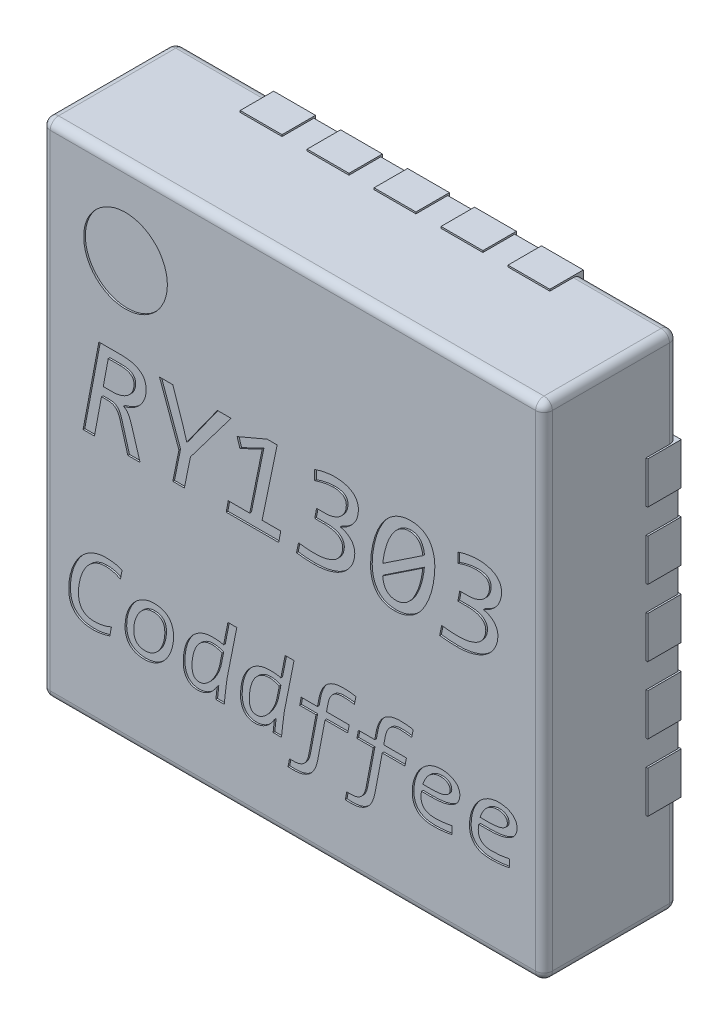
from build123d import *

# Parameters (mm, degrees)
SKETCH_1_W          = 3
SKETCH_1_H          = 3
EXTRUDE_1_DEPTH     = 0.8
SKETCH_3_W          = 0.25
SKETCH_3_H          = 0.31
SKETCH_3_W_2        = 0.31
SKETCH_3_H_2        = 0.25
EXTRUDE_2_DEPTH     = 0.2
EXTRUDE_3_DEPTH     = 0.01
SKETCH_5_R          = 0.25
CUT_EXTRUDE_1_DEPTH = 0.01
FILLET_1_R          = 0.05
FILLET_2_R          = 0.05


with BuildPart() as part:
    # 草图1 → 凸台-拉伸1 (new body)
    with BuildSketch(Plane.XY.offset(0.01)):
        Rectangle(SKETCH_1_W, SKETCH_1_H)
    extrude(amount=EXTRUDE_1_DEPTH)

    # 草图3 → 凸台-拉伸2 (add)
    with BuildSketch(Plane.XY):
        with Locations((0.4, 1.355)):
            Rectangle(SKETCH_3_W, SKETCH_3_H)
        with Locations((0.8, 1.355)):
            Rectangle(SKETCH_3_W, SKETCH_3_H)
        with Locations((0, 1.355)):
            Rectangle(SKETCH_3_W, SKETCH_3_H)
        with Locations((-0.4, 1.355)):
            Rectangle(SKETCH_3_W, SKETCH_3_H)
        with Locations((-0.8, 1.355)):
            Rectangle(SKETCH_3_W, SKETCH_3_H)
        with Locations((1.355, -0.4)):
            Rectangle(SKETCH_3_W_2, SKETCH_3_H_2)
        with Locations((1.355, -0.8)):
            Rectangle(SKETCH_3_W_2, SKETCH_3_H_2)
        with Locations((1.355, 0)):
            Rectangle(SKETCH_3_W_2, SKETCH_3_H_2)
        with Locations((1.355, 0.4)):
            Rectangle(SKETCH_3_W_2, SKETCH_3_H_2)
        with Locations((1.355, 0.8)):
            Rectangle(SKETCH_3_W_2, SKETCH_3_H_2)
        with Locations((-0.4, -1.355)):
            Rectangle(SKETCH_3_W, SKETCH_3_H)
        with Locations((-0.8, -1.355)):
            Rectangle(SKETCH_3_W, SKETCH_3_H)
        with Locations((0, -1.355)):
            Rectangle(SKETCH_3_W, SKETCH_3_H)
        with Locations((0.4, -1.355)):
            Rectangle(SKETCH_3_W, SKETCH_3_H)
        with Locations((0.8, -1.355)):
            Rectangle(SKETCH_3_W, SKETCH_3_H)
        with Locations((-1.355, 0.4)):
            Rectangle(SKETCH_3_W_2, SKETCH_3_H_2)
        with Locations((-1.355, 0.8)):
            Rectangle(SKETCH_3_W_2, SKETCH_3_H_2)
        with Locations((-1.355, 0)):
            Rectangle(SKETCH_3_W_2, SKETCH_3_H_2)
        with Locations((-1.355, -0.4)):
            Rectangle(SKETCH_3_W_2, SKETCH_3_H_2)
        with Locations((-1.355, -0.8)):
            Rectangle(SKETCH_3_W_2, SKETCH_3_H_2)
    extrude(amount=EXTRUDE_2_DEPTH)

    # 草图4 → 凸台-拉伸3 (add)
    with BuildSketch(Plane.XY):
        Polygon((-0.6, 0.9), (-0.9, 0.6), (-0.9, -0.9), (0.9, -0.9), (0.9, 0.9), align=None)
    extrude(amount=EXTRUDE_3_DEPTH)

    # 草图5 → 切除-拉伸1 (cut)
    # profile 1 of 15: a face of its own
    with BuildSketch(Plane.XY.offset(0.81)):
        with Locations((-1, 1)):
            Circle(SKETCH_5_R)
    # profile 2 of 15: a face of its own
    with BuildSketch(Plane.XY.offset(0.81)):
        with BuildLine():
            Line((-0.913043478, 0), (-0.986413043, 0))
            Line((-0.986413043, 0), (-1.032835145, 0.161345109))
            add(Edge.make_bspline(
                [(-1.032835145, 0.161345109), (-1.034602308, 0.167067267), (-1.037871003, 0.177651452), (-1.044714352, 0.191597361), (-1.052128537, 0.203010034), (-1.061114419, 0.211648389), (-1.07139598, 0.217965928), (-1.083111626, 0.221999896), (-1.096306382, 0.224216778), (-1.1055918, 0.224491991), (-1.110507246, 0.224637681)],
                knots=[0, 0, 0, 0, 1.301871799, 2.408051719, 3.372126706, 4.249673638, 5.098074908, 5.979154158, 6.930219327, 8, 8, 8, 8], degree=3))
            Line((-1.110507246, 0.224637681), (-1.14379529, 0.224637681))
            Line((-1.14379529, 0.224637681), (-1.185688406, 0))
            Line((-1.185688406, 0), (-1.253623188, 0))
            Line((-1.253623188, 0), (-1.15942029, 0.5))
            Line((-1.15942029, 0.5), (-1.026154891, 0.5))
            add(Edge.make_bspline(
                [(-1.026154891, 0.5), (-1.020000305, 0.499919349), (-1.008090347, 0.499763278), (-0.990849069, 0.498390289), (-0.974842323, 0.496175515), (-0.960088676, 0.493008026), (-0.94653499, 0.489046513), (-0.934183263, 0.484362363), (-0.923071561, 0.478769042), (-0.913189948, 0.472401967), (-0.904364165, 0.465399214), (-0.896823039, 0.457517325), (-0.890505778, 0.448844561), (-0.885573189, 0.439325379), (-0.881530994, 0.42926362), (-0.878891292, 0.418470354), (-0.877104831, 0.407102182), (-0.876910899, 0.399275137), (-0.876811594, 0.39526721)],
                knots=[0, 0, 0, 0, 1.428775414, 2.764873786, 4.012804054, 5.178099071, 6.265046401, 7.288651419, 8.240944403, 9.147592955, 10.013875543, 10.850579097, 11.672654486, 12.495849996, 13.333883216, 14.184015669, 15.070104566, 16, 16, 16, 16], degree=3))
            add(Edge.make_bspline(
                [(-0.876811594, 0.39526721), (-0.876908286, 0.390468155), (-0.877098586, 0.381023106), (-0.878962758, 0.3671453), (-0.882018439, 0.353797352), (-0.886326693, 0.341038727), (-0.891717183, 0.328886826), (-0.897878708, 0.317232818), (-0.905360245, 0.306392449), (-0.913557148, 0.296014284), (-0.922937568, 0.286513033), (-0.933156373, 0.277651774), (-0.944313661, 0.269451147), (-0.956412998, 0.262035331), (-0.969324775, 0.255299836), (-0.983098434, 0.249629248), (-0.997444759, 0.244411828), (-1.007411035, 0.241807243), (-1.01245471, 0.24048913)],
                knots=[0, 0, 0, 0, 1.031720026, 2.030534343, 3.005241897, 3.972995282, 4.921665738, 5.862349523, 6.803453507, 7.75045548, 8.703353512, 9.670119098, 10.657254079, 11.677768324, 12.719751945, 13.785649931, 14.879374547, 16, 16, 16, 16], degree=3))
            add(Edge.make_bspline(
                [(-1.01245471, 0.24048913), (-1.009293593, 0.239099649), (-1.003014183, 0.23633951), (-0.994707499, 0.230015746), (-0.98762077, 0.222043076), (-0.981672938, 0.212483683), (-0.976449704, 0.201601543), (-0.971322772, 0.189608165), (-0.966601567, 0.176313324), (-0.963767129, 0.166980801), (-0.962296196, 0.162137681)],
                knots=[0, 0, 0, 0, 0.856636413, 1.701668119, 2.572643607, 3.497281282, 4.492452266, 5.573683623, 6.740861098, 8, 8, 8, 8], degree=3))
            Line((-0.962296196, 0.162137681), (-0.913043478, 0))
        make_face()
        with BuildLine():
            add(Edge.make_bspline(
                [(-0.949275362, 0.38451087), (-0.949510887, 0.389037396), (-0.94996063, 0.39768098), (-0.954093096, 0.409749268), (-0.960784661, 0.420100507), (-0.970552948, 0.428292618), (-0.98276664, 0.434631106), (-0.997614182, 0.438905867), (-1.014959884, 0.44161309), (-1.027426301, 0.441884247), (-1.034080616, 0.442028986)],
                knots=[0, 0, 0, 0, 0.932575149, 1.780789645, 2.60257395, 3.448312007, 4.383068545, 5.426411457, 6.626271958, 8, 8, 8, 8], degree=3))
            Line((-1.034080616, 0.442028986), (-1.10326087, 0.442028986))
            Line((-1.10326087, 0.442028986), (-1.133038949, 0.282608696))
            Line((-1.133038949, 0.282608696), (-1.080955616, 0.282608696))
            add(Edge.make_bspline(
                [(-1.080955616, 0.282608696), (-1.07581771, 0.282669913), (-1.065779853, 0.282789514), (-1.051219439, 0.284463354), (-1.037530195, 0.286876314), (-1.024811672, 0.290415604), (-1.013019379, 0.294796294), (-1.002268076, 0.300044384), (-0.992391046, 0.305817054), (-0.983540745, 0.312383137), (-0.975707907, 0.319692249), (-0.968746292, 0.327498382), (-0.962819383, 0.335931901), (-0.957939475, 0.344906752), (-0.954103278, 0.354332812), (-0.951211074, 0.364062092), (-0.949622283, 0.374193007), (-0.949392284, 0.381033474), (-0.949275362, 0.38451087)],
                knots=[0, 0, 0, 0, 1.323424934, 2.585557574, 3.772234431, 4.902602644, 5.982984854, 7.009663973, 7.982204008, 8.927662755, 9.843073413, 10.738895521, 11.618625301, 12.493502107, 13.365942302, 14.237080185, 15.103808318, 16, 16, 16, 16], degree=3))
        make_face(mode=Mode.SUBTRACT)
    # profile 3 of 15: a face of its own
    with BuildSketch(Plane.XY.offset(0.81)):
        Polygon((-0.369565217, 0.5), (-0.612318841, 0.178668478), (-0.648550725, 0), (-0.717391304, 0), (-0.68115942, 0.180140399), (-0.797101449, 0.5), (-0.717957428, 0.5), (-0.656023551, 0.31714221), (-0.634057971, 0.24365942), (-0.587069746, 0.310235507), (-0.450973732, 0.5), align=None)
    # profile 4 of 15: a face of its own
    with BuildSketch(Plane.XY.offset(0.81)):
        Polygon((-0.085031703, 0), (-0.398550725, 0), (-0.386322464, 0.065217391), (-0.258038949, 0.065217391), (-0.183197464, 0.434782609), (-0.316462862, 0.369565217), (-0.333333333, 0.423460145), (-0.154211957, 0.5), (-0.094202899, 0.5), (-0.18432971, 0.065217391), (-0.072463768, 0.065217391), align=None)
    # profile 5 of 15: a face of its own
    with BuildSketch(Plane.XY.offset(0.81)):
        with BuildLine():
            add(Edge.make_bspline(
                [(0.124433877, -0.007246377), (0.114769943, -0.007174452), (0.096033898, -0.007035007), (0.069065418, -0.005549489), (0.044478092, -0.003236222), (0.029016522, -0.001035722), (0.02173913, 0)],
                knots=[0, 0, 0, 0, 1.125244373, 2.181578477, 3.144112525, 4, 4, 4, 4], degree=3))
            Line((0.02173913, 0), (0.033627717, 0.057971014))
            add(Edge.make_bspline(
                [(0.033627717, 0.057971014), (0.041281828, 0.056889443), (0.056857589, 0.054688495), (0.080886421, 0.052504785), (0.106183473, 0.050918556), (0.12352533, 0.050790637), (0.132472826, 0.050724638)],
                knots=[0, 0, 0, 0, 0.934946204, 1.902572078, 2.917836311, 4, 4, 4, 4], degree=3))
            add(Edge.make_bspline(
                [(0.132472826, 0.050724638), (0.137871694, 0.050784165), (0.148302263, 0.050899173), (0.163455158, 0.051941804), (0.177598148, 0.053592103), (0.190783847, 0.055988649), (0.20302509, 0.058925804), (0.214350232, 0.062334078), (0.224844126, 0.066053125), (0.234503044, 0.070231896), (0.243332357, 0.074893052), (0.251398987, 0.079825163), (0.258594115, 0.085220059), (0.26704479, 0.092620254), (0.275964252, 0.102448173), (0.284299964, 0.11496855), (0.290614601, 0.1275698), (0.294291249, 0.140388763), (0.296704414, 0.152685289), (0.296973134, 0.160768738), (0.297101449, 0.164628623)],
                knots=[0, 0, 0, 0, 1.299772521, 2.511149951, 3.655214155, 4.726477618, 5.735947448, 6.684691384, 7.572880921, 8.415310173, 9.216077775, 9.975127322, 10.689392892, 11.378413035, 12.677994941, 13.870132028, 14.9918547, 16.055498095, 17.071491223, 18, 18, 18, 18], degree=3))
            add(Edge.make_bspline(
                [(0.297101449, 0.164628623), (0.29702641, 0.167389957), (0.296880311, 0.172766153), (0.295404195, 0.180524022), (0.292837163, 0.18765729), (0.289458192, 0.194282172), (0.285054494, 0.200300211), (0.279965191, 0.205937108), (0.273876874, 0.210848034), (0.267185334, 0.215445309), (0.259652201, 0.219404428), (0.251321558, 0.222756526), (0.24227149, 0.225761556), (0.228826955, 0.22870126), (0.21051081, 0.231393329), (0.195400323, 0.231715575), (0.1875, 0.231884058)],
                knots=[0, 0, 0, 0, 0.804369065, 1.566071281, 2.289882201, 3.008321537, 3.725833582, 4.457793348, 5.215671894, 5.999924738, 6.821859818, 7.690201543, 8.615699399, 9.597862057, 11.698398745, 14, 14, 14, 14], degree=3))
            Line((0.1875, 0.231884058), (0.130434783, 0.231884058))
            Line((0.130434783, 0.231884058), (0.141530797, 0.289855072))
            Line((0.141530797, 0.289855072), (0.193727355, 0.289855072))
            add(Edge.make_bspline(
                [(0.193727355, 0.289855072), (0.197770019, 0.28993813), (0.205802819, 0.290103166), (0.217713719, 0.291549765), (0.229421663, 0.29365296), (0.240856224, 0.296723921), (0.251860334, 0.300613199), (0.262252696, 0.305441187), (0.272003467, 0.310930769), (0.280995164, 0.317347347), (0.289300752, 0.324435398), (0.296659364, 0.332411528), (0.303193233, 0.341073278), (0.308716348, 0.350497688), (0.313374856, 0.360604601), (0.31644622, 0.371536758), (0.3184563, 0.383078487), (0.318710567, 0.390993575), (0.31884058, 0.395040761)],
                knots=[0, 0, 0, 0, 1.062351751, 2.110900083, 3.150065349, 4.187334327, 5.219799677, 6.214188602, 7.196225628, 8.156981984, 9.113682657, 10.061441281, 11.003992401, 11.960281412, 12.928386697, 13.920545771, 14.936722049, 16, 16, 16, 16], degree=3))
            add(Edge.make_bspline(
                [(0.31884058, 0.395040761), (0.318627779, 0.399409049), (0.318222753, 0.40772327), (0.314442504, 0.419350297), (0.307840459, 0.428958891), (0.298747867, 0.436647737), (0.287191625, 0.442378435), (0.273298889, 0.446493374), (0.256953018, 0.448922703), (0.24525342, 0.449152744), (0.23901721, 0.449275362)],
                knots=[0, 0, 0, 0, 0.954437311, 1.816593178, 2.636964189, 3.474829087, 4.394892396, 5.440256334, 6.635585688, 8, 8, 8, 8], degree=3))
            add(Edge.make_bspline(
                [(0.23901721, 0.449275362), (0.230585106, 0.449008636), (0.213474936, 0.448467402), (0.192076971, 0.444873692), (0.174499142, 0.440782729), (0.16045671, 0.437026183), (0.145647679, 0.432634536), (0.135595446, 0.429265727), (0.130434783, 0.427536232)],
                knots=[0, 0, 0, 0, 1.363894135, 2.7675727, 3.500904345, 4.284566335, 5.119322431, 6, 6, 6, 6], degree=3))
            Line((0.130434783, 0.427536232), (0.130434783, 0.485507246))
            add(Edge.make_bspline(
                [(0.130434783, 0.485507246), (0.135250407, 0.487178145), (0.144999078, 0.490560685), (0.160058334, 0.494792407), (0.175494305, 0.498554143), (0.191155459, 0.50152831), (0.206703228, 0.504060744), (0.221891425, 0.505827517), (0.236468192, 0.507062899), (0.245959301, 0.507186421), (0.250566123, 0.507246377)],
                knots=[0, 0, 0, 0, 0.997467634, 2.019256774, 3.060225063, 4.106213624, 5.138496278, 6.142724634, 7.09851015, 8, 8, 8, 8], degree=3))
            add(Edge.make_bspline(
                [(0.250566123, 0.507246377), (0.256230196, 0.507164392), (0.267235845, 0.50700509), (0.283196858, 0.505636955), (0.298107861, 0.503403139), (0.311921683, 0.500249366), (0.32463199, 0.496284403), (0.336286218, 0.491652201), (0.346817753, 0.486267375), (0.356193895, 0.480070275), (0.364569396, 0.473299337), (0.371686404, 0.465661637), (0.377797682, 0.457454082), (0.382653385, 0.448539715), (0.386516273, 0.439082764), (0.389407535, 0.429078398), (0.390956778, 0.418451288), (0.391186863, 0.41119873), (0.391304348, 0.407495471)],
                knots=[0, 0, 0, 0, 1.397755133, 2.715926088, 3.950337981, 5.116321085, 6.209362646, 7.233383505, 8.208265432, 9.122850261, 10.003061454, 10.859742812, 11.692542171, 12.522209909, 13.357713845, 14.209876032, 15.085937128, 16, 16, 16, 16], degree=3))
            add(Edge.make_bspline(
                [(0.391304348, 0.407495471), (0.391075889, 0.40170498), (0.39059874, 0.389611226), (0.387503086, 0.374449576), (0.384099038, 0.361815904), (0.380245773, 0.352167904), (0.37565008, 0.34245371), (0.3700613, 0.332790112), (0.363475545, 0.323185468), (0.355593189, 0.313858894), (0.346768497, 0.304530801), (0.336749986, 0.295428727), (0.325466004, 0.286677843), (0.312567366, 0.27866103), (0.298386161, 0.270889008), (0.28812331, 0.266518372), (0.282835145, 0.264266304)],
                knots=[0, 0, 0, 0, 1.270586693, 2.65368929, 3.385607181, 4.141207678, 4.930719054, 5.743755761, 6.589659772, 7.484097659, 8.421935785, 9.407473726, 10.453352817, 11.552253419, 12.738743618, 14, 14, 14, 14], degree=3))
            add(Edge.make_bspline(
                [(0.282835145, 0.264266304), (0.288702658, 0.262933381), (0.300322995, 0.260293587), (0.316582218, 0.253298375), (0.331615651, 0.244768503), (0.342337355, 0.235474714), (0.34998766, 0.227347482), (0.354983037, 0.220613996), (0.359309585, 0.213330104), (0.362908646, 0.205499806), (0.365878323, 0.197215796), (0.368060201, 0.188424496), (0.369278912, 0.179155691), (0.369468892, 0.172821918), (0.369565217, 0.169610507)],
                knots=[0, 0, 0, 0, 1.542696212, 3.0552383, 4.528550673, 5.966177289, 6.679723653, 7.393335888, 8.115004393, 8.852457741, 9.603802697, 10.372770565, 11.174946438, 12, 12, 12, 12], degree=3))
            add(Edge.make_bspline(
                [(0.369565217, 0.169610507), (0.369249907, 0.16324946), (0.368597668, 0.150091221), (0.364116534, 0.130184966), (0.356771173, 0.110002564), (0.348013691, 0.093573897), (0.339410398, 0.080822016), (0.331964691, 0.071317208), (0.323578327, 0.062075409), (0.314330812, 0.053014171), (0.304131917, 0.044398614), (0.292945624, 0.036336183), (0.280823694, 0.028737172), (0.267695181, 0.021743052), (0.253563408, 0.0153534), (0.238377902, 0.009737089), (0.222124347, 0.00474186), (0.204813447, 0.000481729), (0.186399363, -0.003150567), (0.166779949, -0.00533129), (0.146015584, -0.007085291), (0.131760005, -0.007191695), (0.124433877, -0.007246377)],
                knots=[0, 0, 0, 0, 1.134649483, 2.347095982, 3.623116724, 4.957586207, 5.656079458, 6.365969811, 7.10973525, 7.881152222, 8.674362301, 9.489255638, 10.339361458, 11.225046133, 12.141230231, 13.104319261, 14.111795072, 15.173357376, 16.284015618, 17.457503136, 18.693377587, 20, 20, 20, 20], degree=3))
        make_face()
    # profile 6 of 15: a face of its own
    with BuildSketch(Plane.XY.offset(0.81)):
        with BuildLine():
            add(Edge.make_bspline(
                [(0.60620471, -0.007246377), (0.600954163, -0.007100602), (0.590685662, -0.006815511), (0.575621763, -0.005030378), (0.561304451, -0.001820549), (0.547681812, 0.002533139), (0.534926149, 0.008306403), (0.523192475, 0.015528222), (0.512336816, 0.023960201), (0.502435251, 0.033718556), (0.493641013, 0.044960187), (0.486022268, 0.057559327), (0.479258239, 0.071407389), (0.473604421, 0.086599729), (0.46923505, 0.103178352), (0.466084159, 0.121090176), (0.46415282, 0.140356399), (0.463899047, 0.153678928), (0.463768116, 0.160552536)],
                knots=[0, 0, 0, 0, 1.007320364, 1.970017588, 2.90453218, 3.818085205, 4.709096538, 5.583269886, 6.455131516, 7.340832138, 8.243184708, 9.185658703, 10.160315356, 11.195836441, 12.289964397, 13.444606486, 14.681573724, 16, 16, 16, 16], degree=3))
            add(Edge.make_bspline(
                [(0.463768116, 0.160552536), (0.463935729, 0.167537206), (0.464293153, 0.182431596), (0.46612872, 0.205945289), (0.469437752, 0.231558287), (0.474131133, 0.258752612), (0.480624205, 0.287022084), (0.488742636, 0.31598611), (0.499050374, 0.344815519), (0.511485981, 0.372952293), (0.526318635, 0.399746733), (0.540528397, 0.420925051), (0.553162682, 0.436743679), (0.563257093, 0.447943578), (0.574167639, 0.458220587), (0.585715521, 0.467806072), (0.598090619, 0.476392615), (0.611147375, 0.484107249), (0.624862459, 0.490939321), (0.639331794, 0.496697372), (0.654556539, 0.501620327), (0.670758477, 0.504725878), (0.687780828, 0.506901657), (0.699418855, 0.507129491), (0.705389493, 0.507246377)],
                knots=[0, 0, 0, 0, 0.983508977, 2.097273836, 3.318505522, 4.618352553, 5.980809812, 7.400391859, 8.850813716, 10.287505912, 11.726367946, 13.157359761, 13.871838869, 14.575246903, 15.278092789, 15.980195145, 16.686247279, 17.396127794, 18.113761176, 18.840950007, 19.587109667, 20.362403165, 21.159866475, 22, 22, 22, 22], degree=3))
            add(Edge.make_bspline(
                [(0.705389493, 0.507246377), (0.710639421, 0.50709752), (0.720906711, 0.506806401), (0.735987586, 0.505063563), (0.750246248, 0.501701637), (0.763802652, 0.497312608), (0.77660482, 0.491690388), (0.788370094, 0.484487563), (0.799301785, 0.476082762), (0.808999215, 0.466092242), (0.81794177, 0.454993882), (0.825596293, 0.44241513), (0.832330365, 0.428591196), (0.838002136, 0.413402453), (0.842313829, 0.396807312), (0.845702325, 0.37893159), (0.847388258, 0.359633777), (0.847677048, 0.346318969), (0.847826087, 0.339447464)],
                knots=[0, 0, 0, 0, 1.007519252, 1.970406553, 2.906703269, 3.813552425, 4.701763106, 5.582294801, 6.454328573, 7.34020407, 8.247226692, 9.183719418, 10.15856851, 11.194294051, 12.288638035, 13.444801513, 14.681313411, 16, 16, 16, 16], degree=3))
            add(Edge.make_bspline(
                [(0.847826087, 0.339447464), (0.847714418, 0.332461789), (0.847475019, 0.317485769), (0.845416159, 0.293872826), (0.842185941, 0.268136366), (0.837444488, 0.240911961), (0.831028573, 0.212648305), (0.822688136, 0.183863575), (0.812539259, 0.155043293), (0.800004572, 0.127040523), (0.785236632, 0.100183139), (0.771081703, 0.078990024), (0.758464011, 0.063151603), (0.748296522, 0.052016223), (0.737323285, 0.041808568), (0.725780816, 0.032226376), (0.713487187, 0.023579017), (0.700425051, 0.015856161), (0.686585402, 0.009102418), (0.672085207, 0.003120548), (0.656737538, -0.001538604), (0.640579704, -0.004756373), (0.623659996, -0.006885139), (0.612099055, -0.007124393), (0.60620471, -0.007246377)],
                knots=[0, 0, 0, 0, 0.983358193, 2.108141662, 3.334653408, 4.634509843, 5.996976958, 7.412925025, 8.851561986, 10.295282677, 11.726935779, 13.162340783, 13.87682506, 14.57631381, 15.283030534, 15.98513797, 16.686843167, 17.396728818, 18.119131638, 18.853242527, 19.602918259, 20.373010585, 21.170479664, 22, 22, 22, 22], degree=3))
        make_face()
        with BuildLine():
            add(Edge.make_bspline(
                [(0.616168478, 0.050724638), (0.620290335, 0.050852364), (0.628397409, 0.051103584), (0.640318951, 0.053181687), (0.651655153, 0.056735837), (0.662522175, 0.061522534), (0.672754747, 0.067582232), (0.68258963, 0.074479755), (0.69170836, 0.082501979), (0.700502021, 0.091195173), (0.708619795, 0.100893696), (0.716328376, 0.111331762), (0.723604044, 0.1225344), (0.732448117, 0.138675922), (0.742591591, 0.159854974), (0.752806209, 0.18646211), (0.761393214, 0.21393164), (0.767590014, 0.242012424), (0.772592827, 0.269726553), (0.774455835, 0.288141352), (0.775362319, 0.297101449)],
                knots=[0, 0, 0, 0, 0.697985219, 1.372832266, 2.04223556, 2.706365949, 3.379696825, 4.053846856, 4.738347739, 5.434602983, 6.146850836, 6.878325688, 7.632068676, 8.407730472, 9.994965438, 11.606242171, 13.232268665, 14.865519972, 16.474854573, 18, 18, 18, 18], degree=3))
            Line((0.775362319, 0.297101449), (0.536231884, 0.137681159))
            add(Edge.make_bspline(
                [(0.536231884, 0.137681159), (0.537021625, 0.131548795), (0.538542355, 0.119740269), (0.542620865, 0.102905817), (0.548803742, 0.087917313), (0.555849368, 0.076962166), (0.562760986, 0.069657507), (0.568428561, 0.064708746), (0.57479484, 0.060574728), (0.581675133, 0.056990075), (0.589224901, 0.054138086), (0.597543111, 0.052092231), (0.606630288, 0.051029099), (0.612920284, 0.050828321), (0.616168478, 0.050724638)],
                knots=[0, 0, 0, 0, 1.67889269, 3.232887858, 4.689415349, 6.065581733, 6.740090105, 7.416154797, 8.104237989, 8.796584627, 9.520106762, 10.290891389, 11.117405419, 12, 12, 12, 12], degree=3))
        make_face(mode=Mode.SUBTRACT)
        with BuildLine():
            add(Edge.make_bspline(
                [(0.696218297, 0.449275362), (0.692095098, 0.44915307), (0.684022596, 0.448913644), (0.672202822, 0.446780891), (0.660930449, 0.44341541), (0.650265343, 0.438580339), (0.640146459, 0.432676938), (0.630615738, 0.425653549), (0.621425448, 0.417892885), (0.612833949, 0.409136003), (0.604754073, 0.399519499), (0.597091086, 0.389172848), (0.589919534, 0.37794782), (0.580884725, 0.361969749), (0.570967942, 0.340634074), (0.560663509, 0.314005129), (0.552242524, 0.286304789), (0.545402114, 0.258216988), (0.540324094, 0.230334526), (0.538106248, 0.211893477), (0.537024457, 0.202898551)],
                knots=[0, 0, 0, 0, 0.699105571, 1.36872642, 2.031204443, 2.690548697, 3.350670022, 4.015496388, 4.69692579, 5.389785013, 6.094150606, 6.826799565, 7.57289987, 8.352941364, 9.939974205, 11.559810885, 13.194567727, 14.848789836, 16.462945086, 18, 18, 18, 18], degree=3))
            Line((0.537024457, 0.202898551), (0.776154891, 0.362318841))
            add(Edge.make_bspline(
                [(0.776154891, 0.362318841), (0.775290177, 0.368426857), (0.773614185, 0.380265434), (0.768652888, 0.396946528), (0.76227571, 0.411966862), (0.754939584, 0.422793389), (0.748050704, 0.43008203), (0.742495959, 0.435071188), (0.736182726, 0.439204903), (0.729414934, 0.442905657), (0.721962465, 0.445671661), (0.714001327, 0.447944294), (0.70530169, 0.448960676), (0.699314513, 0.449168096), (0.696218297, 0.449275362)],
                knots=[0, 0, 0, 0, 1.688192296, 3.272059616, 4.753604763, 6.144763221, 6.8251676, 7.499335038, 8.184828526, 8.888033964, 9.608219138, 10.358298917, 11.151008669, 12, 12, 12, 12], degree=3))
        make_face(mode=Mode.SUBTRACT)
    # profile 7 of 15: a face of its own
    with BuildSketch(Plane.XY.offset(0.81)):
        with BuildLine():
            add(Edge.make_bspline(
                [(0.979506341, -0.007246377), (0.969842407, -0.007174452), (0.951106361, -0.007035007), (0.924137882, -0.005549489), (0.899550556, -0.003236222), (0.884088985, -0.001035722), (0.876811594, 0)],
                knots=[0, 0, 0, 0, 1.125244373, 2.181578477, 3.144112525, 4, 4, 4, 4], degree=3))
            Line((0.876811594, 0), (0.888700181, 0.057971014))
            add(Edge.make_bspline(
                [(0.888700181, 0.057971014), (0.896354292, 0.056889443), (0.911930052, 0.054688495), (0.935958885, 0.052504785), (0.961255936, 0.050918556), (0.978597794, 0.050790637), (0.98754529, 0.050724638)],
                knots=[0, 0, 0, 0, 0.934946204, 1.902572078, 2.917836311, 4, 4, 4, 4], degree=3))
            add(Edge.make_bspline(
                [(0.98754529, 0.050724638), (0.992944158, 0.050784165), (1.003374727, 0.050899173), (1.018527622, 0.051941804), (1.032670611, 0.053592103), (1.045856311, 0.055988649), (1.058097554, 0.058925804), (1.069422696, 0.062334078), (1.07991659, 0.066053125), (1.089575508, 0.070231896), (1.09840482, 0.074893052), (1.106471451, 0.079825163), (1.113666579, 0.085220059), (1.122117254, 0.092620254), (1.131036716, 0.102448173), (1.139372427, 0.11496855), (1.145687064, 0.1275698), (1.149363713, 0.140388763), (1.151776878, 0.152685289), (1.152045598, 0.160768738), (1.152173913, 0.164628623)],
                knots=[0, 0, 0, 0, 1.299772521, 2.511149951, 3.655214155, 4.726477618, 5.735947448, 6.684691384, 7.572880921, 8.415310173, 9.216077775, 9.975127322, 10.689392892, 11.378413035, 12.677994941, 13.870132028, 14.9918547, 16.055498095, 17.071491223, 18, 18, 18, 18], degree=3))
            add(Edge.make_bspline(
                [(1.152173913, 0.164628623), (1.152098873, 0.167389957), (1.151952774, 0.172766153), (1.150476659, 0.180524022), (1.147909627, 0.18765729), (1.144530655, 0.194282172), (1.140126957, 0.200300211), (1.135037655, 0.205937108), (1.128949338, 0.210848034), (1.122257798, 0.215445309), (1.114724665, 0.219404428), (1.106394022, 0.222756526), (1.097343954, 0.225761556), (1.083899419, 0.22870126), (1.065583273, 0.231393329), (1.050472787, 0.231715575), (1.042572464, 0.231884058)],
                knots=[0, 0, 0, 0, 0.804369065, 1.566071281, 2.289882201, 3.008321537, 3.725833582, 4.457793348, 5.215671894, 5.999924738, 6.821859818, 7.690201543, 8.615699399, 9.597862057, 11.698398745, 14, 14, 14, 14], degree=3))
            Line((1.042572464, 0.231884058), (0.985507246, 0.231884058))
            Line((0.985507246, 0.231884058), (0.996603261, 0.289855072))
            Line((0.996603261, 0.289855072), (1.048799819, 0.289855072))
            add(Edge.make_bspline(
                [(1.048799819, 0.289855072), (1.052842483, 0.28993813), (1.060875283, 0.290103166), (1.072786183, 0.291549765), (1.084494127, 0.29365296), (1.095928688, 0.296723921), (1.106932798, 0.300613199), (1.11732516, 0.305441187), (1.127075931, 0.310930769), (1.136067628, 0.317347347), (1.144373216, 0.324435398), (1.151731827, 0.332411528), (1.158265697, 0.341073278), (1.163788811, 0.350497688), (1.168447319, 0.360604601), (1.171518684, 0.371536758), (1.173528764, 0.383078487), (1.17378303, 0.390993575), (1.173913043, 0.395040761)],
                knots=[0, 0, 0, 0, 1.062351751, 2.110900083, 3.150065349, 4.187334327, 5.219799677, 6.214188602, 7.196225628, 8.156981984, 9.113682657, 10.061441281, 11.003992401, 11.960281412, 12.928386697, 13.920545771, 14.936722049, 16, 16, 16, 16], degree=3))
            add(Edge.make_bspline(
                [(1.173913043, 0.395040761), (1.173700243, 0.399409049), (1.173295217, 0.40772327), (1.169514967, 0.419350297), (1.162912923, 0.428958891), (1.153820331, 0.436647737), (1.142264089, 0.442378435), (1.128371353, 0.446493374), (1.112025482, 0.448922703), (1.100325884, 0.449152744), (1.094089674, 0.449275362)],
                knots=[0, 0, 0, 0, 0.954437311, 1.816593178, 2.636964189, 3.474829087, 4.394892396, 5.440256334, 6.635585688, 8, 8, 8, 8], degree=3))
            add(Edge.make_bspline(
                [(1.094089674, 0.449275362), (1.08565757, 0.449008636), (1.0685474, 0.448467402), (1.047149435, 0.444873692), (1.029571605, 0.440782729), (1.015529173, 0.437026183), (1.000720143, 0.432634536), (0.99066791, 0.429265727), (0.985507246, 0.427536232)],
                knots=[0, 0, 0, 0, 1.363894135, 2.7675727, 3.500904345, 4.284566335, 5.119322431, 6, 6, 6, 6], degree=3))
            Line((0.985507246, 0.427536232), (0.985507246, 0.485507246))
            add(Edge.make_bspline(
                [(0.985507246, 0.485507246), (0.990322871, 0.487178145), (1.000071541, 0.490560685), (1.015130797, 0.494792407), (1.030566769, 0.498554143), (1.046227922, 0.50152831), (1.061775692, 0.504060744), (1.076963888, 0.505827517), (1.091540656, 0.507062899), (1.101031764, 0.507186421), (1.105638587, 0.507246377)],
                knots=[0, 0, 0, 0, 0.997467634, 2.019256774, 3.060225063, 4.106213624, 5.138496278, 6.142724634, 7.09851015, 8, 8, 8, 8], degree=3))
            add(Edge.make_bspline(
                [(1.105638587, 0.507246377), (1.111302659, 0.507164392), (1.122308308, 0.50700509), (1.138269322, 0.505636955), (1.153180325, 0.503403139), (1.166994146, 0.500249366), (1.179704454, 0.496284403), (1.191358682, 0.491652201), (1.201890217, 0.486267375), (1.211266359, 0.480070275), (1.21964186, 0.473299337), (1.226758868, 0.465661637), (1.232870146, 0.457454082), (1.237725849, 0.448539715), (1.241588737, 0.439082764), (1.244479999, 0.429078398), (1.246029242, 0.418451288), (1.246259327, 0.41119873), (1.246376812, 0.407495471)],
                knots=[0, 0, 0, 0, 1.397755133, 2.715926088, 3.950337981, 5.116321085, 6.209362646, 7.233383505, 8.208265432, 9.122850261, 10.003061454, 10.859742812, 11.692542171, 12.522209909, 13.357713845, 14.209876032, 15.085937128, 16, 16, 16, 16], degree=3))
            add(Edge.make_bspline(
                [(1.246376812, 0.407495471), (1.246148353, 0.40170498), (1.245671204, 0.389611226), (1.242575549, 0.374449576), (1.239171502, 0.361815904), (1.235318237, 0.352167904), (1.230722543, 0.34245371), (1.225133764, 0.332790112), (1.218548009, 0.323185468), (1.210665653, 0.313858894), (1.20184096, 0.304530801), (1.19182245, 0.295428727), (1.180538468, 0.286677843), (1.16763983, 0.27866103), (1.153458625, 0.270889008), (1.143195773, 0.266518372), (1.137907609, 0.264266304)],
                knots=[0, 0, 0, 0, 1.270586693, 2.65368929, 3.385607181, 4.141207678, 4.930719054, 5.743755761, 6.589659772, 7.484097659, 8.421935785, 9.407473726, 10.453352817, 11.552253419, 12.738743618, 14, 14, 14, 14], degree=3))
            add(Edge.make_bspline(
                [(1.137907609, 0.264266304), (1.143775122, 0.262933381), (1.155395459, 0.260293587), (1.171654681, 0.253298375), (1.186688115, 0.244768503), (1.197409818, 0.235474714), (1.205060124, 0.227347482), (1.210055501, 0.220613996), (1.214382049, 0.213330104), (1.21798111, 0.205499806), (1.220950787, 0.197215796), (1.223132664, 0.188424496), (1.224351375, 0.179155691), (1.224541356, 0.172821918), (1.224637681, 0.169610507)],
                knots=[0, 0, 0, 0, 1.542696212, 3.0552383, 4.528550673, 5.966177289, 6.679723653, 7.393335888, 8.115004393, 8.852457741, 9.603802697, 10.372770565, 11.174946438, 12, 12, 12, 12], degree=3))
            add(Edge.make_bspline(
                [(1.224637681, 0.169610507), (1.224322371, 0.16324946), (1.223670132, 0.150091221), (1.219188998, 0.130184966), (1.211843637, 0.110002564), (1.203086155, 0.093573897), (1.194482862, 0.080822016), (1.187037155, 0.071317208), (1.178650791, 0.062075409), (1.169403276, 0.053014171), (1.15920438, 0.044398614), (1.148018087, 0.036336183), (1.135896158, 0.028737172), (1.122767645, 0.021743052), (1.108635871, 0.0153534), (1.093450365, 0.009737089), (1.077196811, 0.00474186), (1.059885911, 0.000481729), (1.041471827, -0.003150567), (1.021852413, -0.00533129), (1.001088048, -0.007085291), (0.986832469, -0.007191695), (0.979506341, -0.007246377)],
                knots=[0, 0, 0, 0, 1.134649483, 2.347095982, 3.623116724, 4.957586207, 5.656079458, 6.365969811, 7.10973525, 7.881152222, 8.674362301, 9.489255638, 10.339361458, 11.225046133, 12.141230231, 13.104319261, 14.111795072, 15.173357376, 16.284015618, 17.457503136, 18.693377587, 20, 20, 20, 20], degree=3))
        make_face()
    # profile 8 of 15: a face of its own
    with BuildSketch(Plane.XY.offset(0.81)):
        with BuildLine():
            add(Edge.make_bspline(
                [(-1.094112319, -0.988405797), (-1.102564156, -0.991028651), (-1.11911321, -0.99616431), (-1.144216392, -1.001789573), (-1.169619986, -1.005214655), (-1.186734164, -1.005600252), (-1.195471014, -1.005797101)],
                knots=[0, 0, 0, 0, 1.027801072, 2.012477991, 2.985362699, 4, 4, 4, 4], degree=3))
            add(Edge.make_bspline(
                [(-1.195471014, -1.005797101), (-1.201061226, -1.005699923), (-1.211934539, -1.005510904), (-1.227739407, -1.003842915), (-1.242581224, -1.001203116), (-1.25638064, -0.997257079), (-1.269290595, -0.992402883), (-1.281146099, -0.986319654), (-1.292082661, -0.979196366), (-1.301969201, -0.97093464), (-1.31083205, -0.961593372), (-1.318404761, -0.95101404), (-1.324826542, -0.939394653), (-1.330120282, -0.926671284), (-1.334185608, -0.912818123), (-1.336987989, -0.897854968), (-1.338901203, -0.881812437), (-1.339052378, -0.870748762), (-1.339130435, -0.865036232)],
                knots=[0, 0, 0, 0, 1.166309873, 2.268546017, 3.312870259, 4.308219106, 5.259596405, 6.18673121, 7.083277722, 7.977984526, 8.86949054, 9.763131687, 10.685436235, 11.634473633, 12.633326539, 13.692374124, 14.808498833, 16, 16, 16, 16], degree=3))
            add(Edge.make_bspline(
                [(-1.339130435, -0.865036232), (-1.339058007, -0.860082725), (-1.338911217, -0.850043478), (-1.337788641, -0.834899444), (-1.335957817, -0.819488812), (-1.333435351, -0.803922578), (-1.330220026, -0.788276838), (-1.326102584, -0.772785894), (-1.321320591, -0.757443582), (-1.315710607, -0.742319387), (-1.309262624, -0.727493105), (-1.302149829, -0.712966808), (-1.294107722, -0.698927313), (-1.285488676, -0.685243476), (-1.27599498, -0.672200148), (-1.265673459, -0.659968991), (-1.254527332, -0.648564973), (-1.242627165, -0.637954705), (-1.229807166, -0.628378849), (-1.216295532, -0.619652153), (-1.201790028, -0.612294315), (-1.186561219, -0.605774709), (-1.170408217, -0.600602501), (-1.153364264, -0.596914498), (-1.135451748, -0.594570776), (-1.123195856, -0.59432724), (-1.116938406, -0.594202899)],
                knots=[0, 0, 0, 0, 0.914461362, 1.853334108, 2.801969121, 3.778876732, 4.763893439, 5.749556623, 6.736857749, 7.729854755, 8.726038458, 9.72072381, 10.714283917, 11.711714525, 12.705149526, 13.69010314, 14.663760967, 15.647009524, 16.630321284, 17.615353764, 18.612597436, 19.629281783, 20.671144063, 21.738303631, 22.845253083, 24, 24, 24, 24], degree=3))
            add(Edge.make_bspline(
                [(-1.116938406, -0.594202899), (-1.112407863, -0.594250735), (-1.103460105, -0.594345211), (-1.090230499, -0.595226213), (-1.077371102, -0.596410176), (-1.064952882, -0.59834658), (-1.052978513, -0.600779689), (-1.041538066, -0.603733914), (-1.030623792, -0.60725321), (-1.02371318, -0.610156162), (-1.020289855, -0.611594203)],
                knots=[0, 0, 0, 0, 1.099418001, 2.171335069, 3.216954463, 4.232614642, 5.219936943, 6.181496291, 7.099164038, 8, 8, 8, 8], degree=3))
            Line((-1.020289855, -0.611594203), (-1.030978261, -0.663768116))
            add(Edge.make_bspline(
                [(-1.030978261, -0.663768116), (-1.034181049, -0.661932637), (-1.040585767, -0.658262172), (-1.050669658, -0.653740837), (-1.060941125, -0.649661532), (-1.071617308, -0.646429793), (-1.08276465, -0.643747139), (-1.094600396, -0.641848647), (-1.107196113, -0.640780904), (-1.115849408, -0.64064794), (-1.120289855, -0.64057971)],
                knots=[0, 0, 0, 0, 0.94749287, 1.894731857, 2.83505811, 3.784294591, 4.756686583, 5.777821475, 6.859686923, 8, 8, 8, 8], degree=3))
            add(Edge.make_bspline(
                [(-1.120289855, -0.64057971), (-1.124944608, -0.640708114), (-1.134078844, -0.640960088), (-1.147456084, -0.642743754), (-1.160123098, -0.645970572), (-1.172114546, -0.650303493), (-1.183343613, -0.655786856), (-1.193917006, -0.662100624), (-1.203934632, -0.669120724), (-1.213153156, -0.677164678), (-1.221772531, -0.68586364), (-1.229748311, -0.695253284), (-1.237235236, -0.70522042), (-1.246206969, -0.719493202), (-1.256014136, -0.738317858), (-1.265392226, -0.761967035), (-1.27251367, -0.786281542), (-1.277551766, -0.810731621), (-1.280504941, -0.83480062), (-1.280945088, -0.850626716), (-1.28115942, -0.858333333)],
                knots=[0, 0, 0, 0, 0.835990689, 1.640502986, 2.417816419, 3.179499065, 3.926523602, 4.658455982, 5.389725115, 6.120270021, 6.852684384, 7.587343825, 8.331370469, 9.089589716, 10.612848828, 12.136455409, 13.651623142, 15.157592175, 16.615871508, 18, 18, 18, 18], degree=3))
            add(Edge.make_bspline(
                [(-1.28115942, -0.858333333), (-1.281090715, -0.862411477), (-1.280957115, -0.870341494), (-1.279905098, -0.881826918), (-1.277984383, -0.89251408), (-1.275370215, -0.902429018), (-1.27206036, -0.911582649), (-1.267954044, -0.919956058), (-1.263039154, -0.927456336), (-1.257501195, -0.934287596), (-1.251067606, -0.940175481), (-1.2439711, -0.945415303), (-1.236053477, -0.949726475), (-1.227424759, -0.953287379), (-1.218081253, -0.9560895), (-1.207978753, -0.958052523), (-1.197130644, -0.959252066), (-1.189646985, -0.959362969), (-1.185778986, -0.95942029)],
                knots=[0, 0, 0, 0, 1.227777673, 2.387433787, 3.468037588, 4.493389877, 5.471217022, 6.394086917, 7.294245877, 8.166049166, 9.034433233, 9.912658732, 10.815933707, 11.741084229, 12.718911374, 13.747602992, 14.835827506, 16, 16, 16, 16], degree=3))
            add(Edge.make_bspline(
                [(-1.185778986, -0.95942029), (-1.18148861, -0.959358894), (-1.172891624, -0.959235869), (-1.159953007, -0.957969084), (-1.146921231, -0.956084213), (-1.133826711, -0.953461942), (-1.120881405, -0.950146499), (-1.108224948, -0.946118985), (-1.095935621, -0.941553849), (-1.087995282, -0.937996057), (-1.084057971, -0.936231884)],
                knots=[0, 0, 0, 0, 0.979165449, 1.962035789, 2.965097649, 3.984346361, 5.009150236, 6.014104936, 7.015270379, 8, 8, 8, 8], degree=3))
            Line((-1.084057971, -0.936231884), (-1.094112319, -0.988405797))
        make_face()
    # profile 9 of 15: a face of its own
    with BuildSketch(Plane.XY.offset(0.81)):
        with BuildLine():
            add(Edge.make_bspline(
                [(-0.888134058, -1.005797101), (-0.89251613, -1.005716156), (-0.901090798, -1.005557765), (-0.913560474, -1.004150118), (-0.92530433, -1.00204347), (-0.936276557, -0.998924493), (-0.946526395, -0.994979682), (-0.956032868, -0.990052121), (-0.964747349, -0.984211135), (-0.972788908, -0.977621145), (-0.979901711, -0.970032515), (-0.986085995, -0.961536997), (-0.991381772, -0.952200509), (-0.995516988, -0.941871754), (-0.998892545, -0.930759699), (-1.001175207, -0.918733536), (-1.002692613, -0.905866225), (-1.002828339, -0.896985424), (-1.002898551, -0.892391304)],
                knots=[0, 0, 0, 0, 1.141646598, 2.233929725, 3.266416212, 4.247835534, 5.202032763, 6.124121111, 7.03199869, 7.931689465, 8.827932607, 9.734479312, 10.664623906, 11.617360007, 12.628057728, 13.6866895, 14.803303379, 16, 16, 16, 16], degree=3))
            add(Edge.make_bspline(
                [(-1.002898551, -0.892391304), (-1.002628804, -0.883921741), (-1.002089391, -0.866985146), (-0.998666192, -0.846031019), (-0.994914327, -0.829540871), (-0.991189309, -0.817461093), (-0.987098532, -0.805601806), (-0.982247059, -0.794066786), (-0.976865936, -0.78284488), (-0.9707352, -0.772064315), (-0.964165435, -0.761606693), (-0.956876604, -0.751668369), (-0.94914188, -0.742114002), (-0.940712466, -0.733286504), (-0.931790611, -0.725040957), (-0.922245105, -0.717558083), (-0.912251252, -0.710607961), (-0.901573828, -0.704682776), (-0.890502398, -0.699369161), (-0.878904205, -0.694931741), (-0.866787283, -0.691402128), (-0.854178399, -0.688702996), (-0.841003309, -0.687317255), (-0.832067921, -0.687077909), (-0.827536232, -0.686956522)],
                knots=[0, 0, 0, 0, 1.858857387, 3.717159102, 4.649815244, 5.570520451, 6.49093922, 7.403228976, 8.31643355, 9.221759899, 10.12475318, 11.026431456, 11.926182468, 12.821821206, 13.703887938, 14.591170666, 15.482973885, 16.373494926, 17.269010986, 18.177608077, 19.096425929, 20.037735659, 21.004814226, 22, 22, 22, 22], degree=3))
            add(Edge.make_bspline(
                [(-0.827536232, -0.686956522), (-0.823154555, -0.687039925), (-0.814580659, -0.687203125), (-0.802099875, -0.68857714), (-0.790333142, -0.690812615), (-0.779346201, -0.694017399), (-0.769027351, -0.697934435), (-0.759608492, -0.702952678), (-0.750981465, -0.708779038), (-0.743260398, -0.715534151), (-0.73630786, -0.723108556), (-0.730200057, -0.731575863), (-0.725040459, -0.741001157), (-0.720698639, -0.751254835), (-0.717220796, -0.762380317), (-0.714853359, -0.774407747), (-0.71323257, -0.7872748), (-0.713107651, -0.7961601), (-0.713043478, -0.800724638)],
                knots=[0, 0, 0, 0, 1.143056594, 2.236688751, 3.271920425, 4.264294496, 5.219670211, 6.14655428, 7.042485212, 7.930378231, 8.817012025, 9.72005062, 10.647503729, 11.614759953, 12.621478753, 13.682968704, 14.809699572, 16, 16, 16, 16], degree=3))
            add(Edge.make_bspline(
                [(-0.713043478, -0.800724638), (-0.71326869, -0.809105115), (-0.713720844, -0.825930481), (-0.717273827, -0.846721016), (-0.721056433, -0.863174181), (-0.724718577, -0.875243088), (-0.728866186, -0.887126089), (-0.733774751, -0.898649382), (-0.739183613, -0.909881655), (-0.745184245, -0.920720138), (-0.751818599, -0.931146809), (-0.758996031, -0.941170275), (-0.766846963, -0.950600637), (-0.775122997, -0.959545802), (-0.784184191, -0.967631662), (-0.793530721, -0.975324306), (-0.803574249, -0.982100293), (-0.814098118, -0.988236574), (-0.82524678, -0.993439538), (-0.836879376, -0.997929647), (-0.849027355, -1.001454485), (-0.8616555, -1.004013541), (-0.874755627, -1.005445488), (-0.883631966, -1.005678777), (-0.888134058, -1.005797101)],
                knots=[0, 0, 0, 0, 1.84208112, 3.698320055, 4.626249392, 5.555034008, 6.470905589, 7.393590999, 8.308498809, 9.212273784, 10.116951255, 11.025690995, 11.921991869, 12.814742241, 13.703357251, 14.591252183, 15.475488037, 16.365194469, 17.268383561, 18.178675294, 19.105582014, 20.047313385, 21.009594378, 22, 22, 22, 22], degree=3))
        make_face()
        with BuildLine():
            add(Edge.make_bspline(
                [(-0.765217391, -0.806431159), (-0.765266656, -0.803470253), (-0.765362369, -0.797717758), (-0.766181269, -0.789391078), (-0.767523876, -0.781632259), (-0.76943249, -0.774450436), (-0.771819072, -0.767787104), (-0.774972749, -0.761800388), (-0.778465051, -0.756302384), (-0.78260365, -0.751451789), (-0.787251729, -0.747201731), (-0.792338567, -0.743410025), (-0.798037662, -0.740390172), (-0.804115532, -0.737693373), (-0.810782843, -0.73570896), (-0.817959297, -0.734434426), (-0.825577031, -0.733444599), (-0.830823778, -0.733371051), (-0.833514493, -0.733333333)],
                knots=[0, 0, 0, 0, 1.240615765, 2.410287131, 3.502446362, 4.53678098, 5.521636354, 6.461062037, 7.366555277, 8.246309069, 9.123876229, 10.002081719, 10.896813424, 11.820599536, 12.785334428, 13.802813944, 14.873206279, 16, 16, 16, 16], degree=3))
            add(Edge.make_bspline(
                [(-0.833514493, -0.733333333), (-0.836630376, -0.733379947), (-0.842738728, -0.733471329), (-0.851721701, -0.734878984), (-0.86041325, -0.736743822), (-0.868667169, -0.739751445), (-0.876584756, -0.74326561), (-0.884123736, -0.747459785), (-0.891302511, -0.752243138), (-0.900213148, -0.759552823), (-0.910553026, -0.769874119), (-0.921264859, -0.78399366), (-0.930258208, -0.799518421), (-0.937692093, -0.815946738), (-0.943529146, -0.833150165), (-0.947568407, -0.850823326), (-0.950249709, -0.868487775), (-0.950568457, -0.880214327), (-0.950724638, -0.885960145)],
                knots=[0, 0, 0, 0, 0.701318591, 1.374859408, 2.044954982, 2.701265056, 3.349948515, 3.995591952, 4.642846591, 5.291030321, 6.590001898, 7.924949826, 9.272735746, 10.62470543, 11.982347069, 13.358748851, 14.705830486, 16, 16, 16, 16], degree=3))
            add(Edge.make_bspline(
                [(-0.950724638, -0.885960145), (-0.950675905, -0.88892111), (-0.950581226, -0.894673718), (-0.949752132, -0.903029228), (-0.9484266, -0.910819735), (-0.94652098, -0.918037683), (-0.94407502, -0.924685091), (-0.941109155, -0.930783303), (-0.937529078, -0.936271825), (-0.933459832, -0.94120336), (-0.928773449, -0.945498006), (-0.92358446, -0.949199749), (-0.917959511, -0.952416799), (-0.911780717, -0.954910047), (-0.905182794, -0.957085848), (-0.897978463, -0.958306908), (-0.890366154, -0.959312354), (-0.885118643, -0.959383701), (-0.882427536, -0.95942029)],
                knots=[0, 0, 0, 0, 1.237296598, 2.403838601, 3.505505571, 4.537072909, 5.519293382, 6.461798251, 7.364868917, 8.251926422, 9.127145721, 10.013215261, 10.911689218, 11.828064219, 12.793935007, 13.808692338, 14.876220925, 16, 16, 16, 16], degree=3))
            add(Edge.make_bspline(
                [(-0.882427536, -0.95942029), (-0.879284778, -0.959317976), (-0.873098224, -0.959116571), (-0.864007051, -0.957983799), (-0.855358472, -0.955831367), (-0.847090846, -0.953064093), (-0.839255216, -0.949446137), (-0.831732563, -0.945333004), (-0.824661201, -0.940470505), (-0.815653909, -0.933322138), (-0.805419719, -0.922892697), (-0.794787489, -0.908710738), (-0.785642485, -0.893244693), (-0.77823577, -0.876686392), (-0.772458942, -0.859409274), (-0.768346527, -0.841694422), (-0.765696401, -0.823992708), (-0.765374928, -0.812206797), (-0.765217391, -0.806431159)],
                knots=[0, 0, 0, 0, 0.707243642, 1.392216721, 2.056153913, 2.709160199, 3.350582067, 3.995161195, 4.635719292, 5.2785782, 6.580220427, 7.908859017, 9.257864901, 10.613796069, 11.982074077, 13.349593163, 14.701178851, 16, 16, 16, 16], degree=3))
        make_face(mode=Mode.SUBTRACT)
    # profile 10 of 15: a face of its own
    with BuildSketch(Plane.XY.offset(0.81)):
        with BuildLine():
            add(Edge.make_bspline(
                [(-0.479619565, -0.686956522), (-0.476116634, -0.686962839), (-0.469380415, -0.686974989), (-0.459717739, -0.687372701), (-0.450890935, -0.687863654), (-0.440388414, -0.688963051), (-0.428120787, -0.690818708), (-0.418731383, -0.693333119), (-0.414130435, -0.694565217)],
                knots=[0, 0, 0, 0, 0.952879262, 1.832409507, 2.630706935, 3.35732455, 4.705049526, 6, 6, 6, 6], degree=3))
            Line((-0.414130435, -0.694565217), (-0.388405797, -0.565217391))
            Line((-0.388405797, -0.565217391), (-0.335235507, -0.565217391))
            Line((-0.335235507, -0.565217391), (-0.393478261, -0.857971014))
            add(Edge.make_bspline(
                [(-0.393478261, -0.857971014), (-0.393878083, -0.860234291), (-0.394788278, -0.865386633), (-0.395849398, -0.872275595), (-0.396804727, -0.878886412), (-0.397468186, -0.884910474), (-0.398440646, -0.891748358), (-0.399301309, -0.899487319), (-0.400316232, -0.908120298), (-0.401408419, -0.917751455), (-0.402558565, -0.928446331), (-0.403946533, -0.940245077), (-0.405436684, -0.953251066), (-0.40679079, -0.967612472), (-0.408612981, -0.983323), (-0.409680126, -0.994291558), (-0.410235507, -1)],
                knots=[0, 0, 0, 0, 0.674832782, 1.536254714, 2.046545403, 2.635956164, 3.315547478, 4.074318507, 4.92217534, 5.867929057, 6.920396456, 8.080568018, 9.356256233, 10.76418106, 12.315960681, 14, 14, 14, 14], degree=3))
            Line((-0.410235507, -1), (-0.460235507, -1))
            Line((-0.460235507, -1), (-0.452626812, -0.928804348))
            add(Edge.make_bspline(
                [(-0.452626812, -0.928804348), (-0.456174618, -0.934723765), (-0.46308337, -0.946250827), (-0.475475658, -0.961612817), (-0.488804392, -0.975015387), (-0.503322876, -0.98608478), (-0.518695692, -0.994873769), (-0.534787624, -1.001205802), (-0.551570104, -1.005061333), (-0.562993369, -1.00555056), (-0.56875, -1.005797101)],
                knots=[0, 0, 0, 0, 1.131397534, 2.203205121, 3.229835287, 4.226847727, 5.189950431, 6.12668795, 7.055964661, 8, 8, 8, 8], degree=3))
            add(Edge.make_bspline(
                [(-0.56875, -1.005797101), (-0.572316881, -1.00571479), (-0.579206664, -1.005555798), (-0.589208691, -1.0042004), (-0.598451777, -1.001820047), (-0.607055546, -0.998682806), (-0.614890771, -0.994569557), (-0.622029351, -0.989628468), (-0.628467736, -0.983903992), (-0.634253175, -0.977423074), (-0.639186754, -0.970116468), (-0.64356892, -0.962224106), (-0.647212355, -0.953633507), (-0.650068211, -0.944361991), (-0.652313627, -0.934488101), (-0.653955452, -0.92408056), (-0.654825855, -0.913148856), (-0.654989015, -0.905707899), (-0.655072464, -0.901902174)],
                knots=[0, 0, 0, 0, 1.114413261, 2.152599024, 3.145817099, 4.092261941, 5.008109593, 5.903259949, 6.798907473, 7.694554997, 8.610597055, 9.548157557, 10.512079284, 11.520774242, 12.57597221, 13.674290854, 14.810501189, 16, 16, 16, 16], degree=3))
            add(Edge.make_bspline(
                [(-0.655072464, -0.901902174), (-0.654939484, -0.894619623), (-0.65467678, -0.880232867), (-0.652401395, -0.858993819), (-0.648943935, -0.838391876), (-0.643931835, -0.818569917), (-0.637705692, -0.799634356), (-0.629831111, -0.781918225), (-0.620803307, -0.76534164), (-0.610358346, -0.750056249), (-0.598545582, -0.736125748), (-0.585394815, -0.723656638), (-0.570861915, -0.7128328), (-0.555131725, -0.703504928), (-0.538070277, -0.696019723), (-0.519663226, -0.690804363), (-0.500054609, -0.68755523), (-0.486546886, -0.687159479), (-0.479619565, -0.686956522)],
                knots=[0, 0, 0, 0, 1.122066352, 2.216653982, 3.288432494, 4.339154487, 5.364795967, 6.356519679, 7.322841687, 8.270211146, 9.2044617, 10.132724934, 11.056873547, 11.991402185, 12.945819445, 13.919296721, 14.932929065, 16, 16, 16, 16], degree=3))
        make_face()
        with BuildLine():
            add(Edge.make_bspline(
                [(-0.602898551, -0.895923913), (-0.602789702, -0.900610687), (-0.602582928, -0.909513942), (-0.600708121, -0.922087819), (-0.59758136, -0.933090339), (-0.593231709, -0.942520924), (-0.58725884, -0.950171399), (-0.579514257, -0.955608221), (-0.570174011, -0.958886017), (-0.563434046, -0.959235599), (-0.559873188, -0.95942029)],
                knots=[0, 0, 0, 0, 1.29322691, 2.456685177, 3.498548183, 4.441719091, 5.307346128, 6.144495858, 7.019700473, 8, 8, 8, 8], degree=3))
            add(Edge.make_bspline(
                [(-0.559873188, -0.95942029), (-0.557663348, -0.95935815), (-0.553212263, -0.959232986), (-0.546570947, -0.957961518), (-0.539904781, -0.956085361), (-0.53097632, -0.952334341), (-0.519916156, -0.946010571), (-0.507095294, -0.936342595), (-0.494890968, -0.924447323), (-0.483341505, -0.910750059), (-0.472644438, -0.895590116), (-0.462925087, -0.879258763), (-0.454024557, -0.862141872), (-0.44695049, -0.844244237), (-0.440814753, -0.826592413), (-0.438150958, -0.814702901), (-0.436865942, -0.808967391)],
                knots=[0, 0, 0, 0, 0.449362803, 0.905111708, 1.371998053, 1.857099344, 2.87260121, 3.956832971, 5.11746798, 6.334167092, 7.599571547, 8.889795871, 10.201004841, 11.521587451, 12.804411819, 14, 14, 14, 14], degree=3))
            Line((-0.436865942, -0.808967391), (-0.423369565, -0.74067029))
            add(Edge.make_bspline(
                [(-0.423369565, -0.74067029), (-0.428230447, -0.73876764), (-0.437965305, -0.734957215), (-0.45287109, -0.730951001), (-0.467349932, -0.728146784), (-0.476830454, -0.727733054), (-0.48134058, -0.727536232)],
                knots=[0, 0, 0, 0, 1.047178837, 2.097178493, 3.09477923, 4, 4, 4, 4], degree=3))
            add(Edge.make_bspline(
                [(-0.48134058, -0.727536232), (-0.485421995, -0.727635669), (-0.49334761, -0.727828764), (-0.504869802, -0.729465963), (-0.515556244, -0.732266998), (-0.52545108, -0.736100073), (-0.534506017, -0.740886101), (-0.543004956, -0.746216212), (-0.550805059, -0.752318346), (-0.557958376, -0.759044246), (-0.564526998, -0.766277455), (-0.570289615, -0.774148936), (-0.575615357, -0.782391555), (-0.581664088, -0.794092296), (-0.58797038, -0.809263186), (-0.594095752, -0.827720032), (-0.598261992, -0.846224192), (-0.601048472, -0.864057667), (-0.602462389, -0.880593057), (-0.602760199, -0.891060923), (-0.602898551, -0.895923913)],
                knots=[0, 0, 0, 0, 0.948237405, 1.84136254, 2.697471858, 3.510602768, 4.30150909, 5.074341284, 5.839328887, 6.59889052, 7.354128947, 8.106362348, 8.863586663, 9.632586607, 11.163945054, 12.677320379, 14.146299986, 15.566469154, 16.8694701, 18, 18, 18, 18], degree=3))
        make_face(mode=Mode.SUBTRACT)
    # profile 11 of 15: a face of its own
    with BuildSketch(Plane.XY.offset(0.81)):
        with BuildLine():
            add(Edge.make_bspline(
                [(-0.13759058, -0.686956522), (-0.134087649, -0.686962839), (-0.12735143, -0.686974989), (-0.117688754, -0.687372701), (-0.10886195, -0.687863654), (-0.098359428, -0.688963051), (-0.086091801, -0.690818708), (-0.076702397, -0.693333119), (-0.072101449, -0.694565217)],
                knots=[0, 0, 0, 0, 0.952879262, 1.832409507, 2.630706935, 3.35732455, 4.705049526, 6, 6, 6, 6], degree=3))
            Line((-0.072101449, -0.694565217), (-0.046376812, -0.565217391))
            Line((-0.046376812, -0.565217391), (0.006793478, -0.565217391))
            Line((0.006793478, -0.565217391), (-0.051449275, -0.857971014))
            add(Edge.make_bspline(
                [(-0.051449275, -0.857971014), (-0.051849098, -0.860234291), (-0.052759292, -0.865386633), (-0.053820413, -0.872275595), (-0.054775741, -0.878886412), (-0.055439201, -0.884910474), (-0.056411661, -0.891748358), (-0.057272324, -0.899487319), (-0.058287246, -0.908120298), (-0.059379433, -0.917751455), (-0.06052958, -0.928446331), (-0.061917547, -0.940245077), (-0.063407698, -0.953251066), (-0.064761804, -0.967612472), (-0.066583995, -0.983323), (-0.06765114, -0.994291558), (-0.068206522, -1)],
                knots=[0, 0, 0, 0, 0.674832782, 1.536254714, 2.046545403, 2.635956164, 3.315547478, 4.074318507, 4.92217534, 5.867929057, 6.920396456, 8.080568018, 9.356256233, 10.76418106, 12.315960681, 14, 14, 14, 14], degree=3))
            Line((-0.068206522, -1), (-0.118206522, -1))
            Line((-0.118206522, -1), (-0.110597826, -0.928804348))
            add(Edge.make_bspline(
                [(-0.110597826, -0.928804348), (-0.114145632, -0.934723765), (-0.121054384, -0.946250827), (-0.133446673, -0.961612817), (-0.146775407, -0.975015387), (-0.16129389, -0.98608478), (-0.176666707, -0.994873769), (-0.192758638, -1.001205802), (-0.209541118, -1.005061333), (-0.220964384, -1.00555056), (-0.226721014, -1.005797101)],
                knots=[0, 0, 0, 0, 1.131397534, 2.203205121, 3.229835287, 4.226847727, 5.189950431, 6.12668795, 7.055964661, 8, 8, 8, 8], degree=3))
            add(Edge.make_bspline(
                [(-0.226721014, -1.005797101), (-0.230287896, -1.00571479), (-0.237177679, -1.005555798), (-0.247179706, -1.0042004), (-0.256422791, -1.001820047), (-0.26502656, -0.998682806), (-0.272861786, -0.994569557), (-0.280000366, -0.989628468), (-0.28643875, -0.983903992), (-0.29222419, -0.977423074), (-0.297157768, -0.970116468), (-0.301539934, -0.962224106), (-0.305183369, -0.953633507), (-0.308039226, -0.944361991), (-0.310284641, -0.934488101), (-0.311926467, -0.92408056), (-0.312796869, -0.913148856), (-0.312960029, -0.905707899), (-0.313043478, -0.901902174)],
                knots=[0, 0, 0, 0, 1.114413261, 2.152599024, 3.145817099, 4.092261941, 5.008109593, 5.903259949, 6.798907473, 7.694554997, 8.610597055, 9.548157557, 10.512079284, 11.520774242, 12.57597221, 13.674290854, 14.810501189, 16, 16, 16, 16], degree=3))
            add(Edge.make_bspline(
                [(-0.313043478, -0.901902174), (-0.312910498, -0.894619623), (-0.312647794, -0.880232867), (-0.31037241, -0.858993819), (-0.306914949, -0.838391876), (-0.30190285, -0.818569917), (-0.295676706, -0.799634356), (-0.287802126, -0.781918225), (-0.278774322, -0.76534164), (-0.26832936, -0.750056249), (-0.256516596, -0.736125748), (-0.24336583, -0.723656638), (-0.228832929, -0.7128328), (-0.21310274, -0.703504928), (-0.196041291, -0.696019723), (-0.17763424, -0.690804363), (-0.158025624, -0.68755523), (-0.1445179, -0.687159479), (-0.13759058, -0.686956522)],
                knots=[0, 0, 0, 0, 1.122066352, 2.216653982, 3.288432494, 4.339154487, 5.364795967, 6.356519679, 7.322841687, 8.270211146, 9.2044617, 10.132724934, 11.056873547, 11.991402185, 12.945819445, 13.919296721, 14.932929065, 16, 16, 16, 16], degree=3))
        make_face()
        with BuildLine():
            add(Edge.make_bspline(
                [(-0.260869565, -0.895923913), (-0.260760717, -0.900610687), (-0.260553942, -0.909513942), (-0.258679135, -0.922087819), (-0.255552374, -0.933090339), (-0.251202723, -0.942520924), (-0.245229854, -0.950171399), (-0.237485272, -0.955608221), (-0.228145026, -0.958886017), (-0.22140506, -0.959235599), (-0.217844203, -0.95942029)],
                knots=[0, 0, 0, 0, 1.29322691, 2.456685177, 3.498548183, 4.441719091, 5.307346128, 6.144495858, 7.019700473, 8, 8, 8, 8], degree=3))
            add(Edge.make_bspline(
                [(-0.217844203, -0.95942029), (-0.215634363, -0.95935815), (-0.211183278, -0.959232986), (-0.204541962, -0.957961518), (-0.197875796, -0.956085361), (-0.188947335, -0.952334341), (-0.177887171, -0.946010571), (-0.165066309, -0.936342595), (-0.152861983, -0.924447323), (-0.14131252, -0.910750059), (-0.130615453, -0.895590116), (-0.120896101, -0.879258763), (-0.111995571, -0.862141872), (-0.104921505, -0.844244237), (-0.098785767, -0.826592413), (-0.096121973, -0.814702901), (-0.094836957, -0.808967391)],
                knots=[0, 0, 0, 0, 0.449362803, 0.905111708, 1.371998053, 1.857099344, 2.87260121, 3.956832971, 5.11746798, 6.334167092, 7.599571547, 8.889795871, 10.201004841, 11.521587451, 12.804411819, 14, 14, 14, 14], degree=3))
            Line((-0.094836957, -0.808967391), (-0.08134058, -0.74067029))
            add(Edge.make_bspline(
                [(-0.08134058, -0.74067029), (-0.086201462, -0.73876764), (-0.095936319, -0.734957215), (-0.110842104, -0.730951001), (-0.125320947, -0.728146784), (-0.134801468, -0.727733054), (-0.139311594, -0.727536232)],
                knots=[0, 0, 0, 0, 1.047178837, 2.097178493, 3.09477923, 4, 4, 4, 4], degree=3))
            add(Edge.make_bspline(
                [(-0.139311594, -0.727536232), (-0.143393009, -0.727635669), (-0.151318625, -0.727828764), (-0.162840816, -0.729465963), (-0.173527258, -0.732266998), (-0.183422094, -0.736100073), (-0.192477032, -0.740886101), (-0.200975971, -0.746216212), (-0.208776073, -0.752318346), (-0.215929391, -0.759044246), (-0.222498012, -0.766277455), (-0.22826063, -0.774148936), (-0.233586371, -0.782391555), (-0.239635102, -0.794092296), (-0.245941394, -0.809263186), (-0.252066766, -0.827720032), (-0.256233006, -0.846224192), (-0.259019486, -0.864057667), (-0.260433403, -0.880593057), (-0.260731213, -0.891060923), (-0.260869565, -0.895923913)],
                knots=[0, 0, 0, 0, 0.948237405, 1.84136254, 2.697471858, 3.510602768, 4.30150909, 5.074341284, 5.839328887, 6.59889052, 7.354128947, 8.106362348, 8.863586663, 9.632586607, 11.163945054, 12.677320379, 14.146299986, 15.566469154, 16.8694701, 18, 18, 18, 18], degree=3))
        make_face(mode=Mode.SUBTRACT)
    # profile 12 of 15: a face of its own
    with BuildSketch(Plane.XY.offset(0.81)):
        with BuildLine():
            add(Edge.make_bspline(
                [(0.148731884, -1.00634058), (0.147617022, -1.01178963), (0.145459459, -1.022335039), (0.14130257, -1.037420018), (0.136430745, -1.051193765), (0.130915018, -1.063736825), (0.124568262, -1.075058482), (0.117663218, -1.085488898), (0.109696148, -1.094728645), (0.101059158, -1.103057969), (0.091562443, -1.110368545), (0.081184284, -1.116617716), (0.069981206, -1.12188782), (0.057935812, -1.126154035), (0.044987245, -1.129426908), (0.031064968, -1.131591997), (0.016187458, -1.13312875), (0.005922157, -1.133263776), (0.000634058, -1.133333333)],
                knots=[0, 0, 0, 0, 1.230541562, 2.381435688, 3.459179677, 4.461154228, 5.409265584, 6.328401861, 7.224121817, 8.10306401, 8.979717751, 9.870039045, 10.778624224, 11.714795467, 12.693556841, 13.729354659, 14.830292694, 16, 16, 16, 16], degree=3))
            add(Edge.make_bspline(
                [(0.000634058, -1.133333333), (-0.001630346, -1.133303486), (-0.006582283, -1.133238213), (-0.01419712, -1.133130243), (-0.021801579, -1.132637091), (-0.026721157, -1.132307499), (-0.028985507, -1.132155797)],
                knots=[0, 0, 0, 0, 0.916566605, 2.004403543, 3.081480481, 4, 4, 4, 4], degree=3))
            Line((-0.028985507, -1.132155797), (-0.020289855, -1.086956522))
            add(Edge.make_bspline(
                [(-0.020289855, -1.086956522), (-0.015700483, -1.086956522), (-0.006853865, -1.086956522), (0.001992754, -1.086956522), (0.00625, -1.086956522)],
                knots=[0, 0, 0, 0, 1.037542662, 2, 2, 2, 2], degree=3))
            add(Edge.make_bspline(
                [(0.00625, -1.086956522), (0.009241759, -1.086915272), (0.015088896, -1.086834653), (0.023593697, -1.085890307), (0.031657254, -1.084459336), (0.039255376, -1.082413443), (0.046379093, -1.079630592), (0.053077544, -1.07641557), (0.059312113, -1.072574342), (0.065047575, -1.068105767), (0.070382828, -1.0629631), (0.075258287, -1.057060682), (0.079705415, -1.050408604), (0.083688048, -1.043032626), (0.087221041, -1.034939269), (0.090275253, -1.026081595), (0.093018324, -1.016505102), (0.094398631, -1.009793301), (0.095108696, -1.00634058)],
                knots=[0, 0, 0, 0, 1.079686829, 2.110155707, 3.085163963, 4.034546179, 4.945539966, 5.842600549, 6.713856492, 7.583884064, 8.462744629, 9.383921057, 10.342334831, 11.347172967, 12.406415223, 13.526879592, 14.727763661, 16, 16, 16, 16], degree=3))
            Line((0.095108696, -1.00634058), (0.138043478, -0.779710145))
            Line((0.138043478, -0.779710145), (0.04057971, -0.779710145))
            Line((0.04057971, -0.779710145), (0.049365942, -0.733333333))
            Line((0.049365942, -0.733333333), (0.14692029, -0.733333333))
            Line((0.14692029, -0.733333333), (0.155706522, -0.687137681))
            add(Edge.make_bspline(
                [(0.155706522, -0.687137681), (0.156788201, -0.681868548), (0.158898512, -0.671588696), (0.163070873, -0.65685064), (0.167930094, -0.64313382), (0.173713746, -0.630580696), (0.179844199, -0.618877729), (0.187014177, -0.608413286), (0.194784172, -0.59893127), (0.203381585, -0.590520931), (0.212777383, -0.583112863), (0.223065359, -0.576766594), (0.234221897, -0.571415229), (0.246205095, -0.566928578), (0.259159873, -0.563642863), (0.272966084, -0.561224917), (0.287643413, -0.559614881), (0.297731107, -0.559486204), (0.302898551, -0.55942029)],
                knots=[0, 0, 0, 0, 1.194450244, 2.330320955, 3.399511415, 4.423007577, 5.398233684, 6.330159548, 7.235225641, 8.117339257, 8.996132324, 9.887603815, 10.796463712, 11.740759542, 12.724892428, 13.760251112, 14.852683714, 16, 16, 16, 16], degree=3))
            add(Edge.make_bspline(
                [(0.302898551, -0.55942029), (0.308547129, -0.559516107), (0.320402337, -0.559717206), (0.338713319, -0.561157392), (0.357744131, -0.563277503), (0.370481133, -0.565541453), (0.376811594, -0.566666667)],
                knots=[0, 0, 0, 0, 0.911446406, 1.912938903, 2.962702695, 4, 4, 4, 4], degree=3))
            Line((0.376811594, -0.566666667), (0.367300725, -0.611594203))
            add(Edge.make_bspline(
                [(0.367300725, -0.611594203), (0.361509571, -0.610731498), (0.349893242, -0.60900102), (0.332391753, -0.607268144), (0.31487425, -0.60597458), (0.303202891, -0.605856221), (0.297373188, -0.605797101)],
                knots=[0, 0, 0, 0, 1.00020693, 2.006289874, 3.004166046, 4, 4, 4, 4], degree=3))
            add(Edge.make_bspline(
                [(0.297373188, -0.605797101), (0.294412141, -0.60584012), (0.288656272, -0.605923741), (0.280228776, -0.606839379), (0.272292635, -0.60843209), (0.264710345, -0.610304618), (0.257703414, -0.613140925), (0.251051713, -0.616313546), (0.244968228, -0.620319939), (0.239175142, -0.624698711), (0.234000324, -0.629983764), (0.229170335, -0.635869705), (0.224811932, -0.642571703), (0.220839237, -0.649993166), (0.217295728, -0.658203776), (0.214247729, -0.667177455), (0.211627627, -0.676898676), (0.210230366, -0.683657394), (0.20951087, -0.687137681)],
                knots=[0, 0, 0, 0, 1.070260168, 2.0804389, 3.058799095, 3.996106414, 4.898172692, 5.786663282, 6.655695763, 7.526919315, 8.406852598, 9.322358342, 10.276048987, 11.291873848, 12.362579262, 13.505209524, 14.715350128, 16, 16, 16, 16], degree=3))
            Line((0.20951087, -0.687137681), (0.200634058, -0.733333333))
            Line((0.200634058, -0.733333333), (0.336231884, -0.733333333))
            Line((0.336231884, -0.733333333), (0.327264493, -0.779710145))
            Line((0.327264493, -0.779710145), (0.191757246, -0.779710145))
            Line((0.191757246, -0.779710145), (0.148731884, -1.00634058))
        make_face()
    # profile 13 of 15: a face of its own
    with BuildSketch(Plane.XY.offset(0.81)):
        with BuildLine():
            add(Edge.make_bspline(
                [(0.49076087, -1.00634058), (0.489646008, -1.01178963), (0.487488445, -1.022335039), (0.483331556, -1.037420018), (0.478459731, -1.051193765), (0.472944004, -1.063736825), (0.466597247, -1.075058482), (0.459692204, -1.085488898), (0.451725133, -1.094728645), (0.443088144, -1.103057969), (0.433591428, -1.110368545), (0.42321327, -1.116617716), (0.412010191, -1.12188782), (0.399964797, -1.126154035), (0.387016231, -1.129426908), (0.373093954, -1.131591997), (0.358216444, -1.13312875), (0.347951143, -1.133263776), (0.342663043, -1.133333333)],
                knots=[0, 0, 0, 0, 1.230541562, 2.381435688, 3.459179677, 4.461154228, 5.409265584, 6.328401861, 7.224121817, 8.10306401, 8.979717751, 9.870039045, 10.778624224, 11.714795467, 12.693556841, 13.729354659, 14.830292694, 16, 16, 16, 16], degree=3))
            add(Edge.make_bspline(
                [(0.342663043, -1.133333333), (0.340398639, -1.133303486), (0.335446702, -1.133238213), (0.327831866, -1.133130243), (0.320227406, -1.132637091), (0.315307828, -1.132307499), (0.313043478, -1.132155797)],
                knots=[0, 0, 0, 0, 0.916566605, 2.004403543, 3.081480481, 4, 4, 4, 4], degree=3))
            Line((0.313043478, -1.132155797), (0.32173913, -1.086956522))
            add(Edge.make_bspline(
                [(0.32173913, -1.086956522), (0.326328502, -1.086956522), (0.335175121, -1.086956522), (0.344021739, -1.086956522), (0.348278986, -1.086956522)],
                knots=[0, 0, 0, 0, 1.037542662, 2, 2, 2, 2], degree=3))
            add(Edge.make_bspline(
                [(0.348278986, -1.086956522), (0.351270744, -1.086915272), (0.357117881, -1.086834653), (0.365622683, -1.085890307), (0.373686239, -1.084459336), (0.381284362, -1.082413443), (0.388408078, -1.079630592), (0.39510653, -1.07641557), (0.401341098, -1.072574342), (0.40707656, -1.068105767), (0.412411814, -1.0629631), (0.417287272, -1.057060682), (0.421734401, -1.050408604), (0.425717034, -1.043032626), (0.429250027, -1.034939269), (0.432304239, -1.026081595), (0.43504731, -1.016505102), (0.436427616, -1.009793301), (0.437137681, -1.00634058)],
                knots=[0, 0, 0, 0, 1.079686829, 2.110155707, 3.085163963, 4.034546179, 4.945539966, 5.842600549, 6.713856492, 7.583884064, 8.462744629, 9.383921057, 10.342334831, 11.347172967, 12.406415223, 13.526879592, 14.727763661, 16, 16, 16, 16], degree=3))
            Line((0.437137681, -1.00634058), (0.480072464, -0.779710145))
            Line((0.480072464, -0.779710145), (0.382608696, -0.779710145))
            Line((0.382608696, -0.779710145), (0.391394928, -0.733333333))
            Line((0.391394928, -0.733333333), (0.488949275, -0.733333333))
            Line((0.488949275, -0.733333333), (0.497735507, -0.687137681))
            add(Edge.make_bspline(
                [(0.497735507, -0.687137681), (0.498817187, -0.681868548), (0.500927497, -0.671588696), (0.505099859, -0.65685064), (0.50995908, -0.64313382), (0.515742731, -0.630580696), (0.521873185, -0.618877729), (0.529043162, -0.608413286), (0.536813157, -0.59893127), (0.54541057, -0.590520931), (0.554806368, -0.583112863), (0.565094345, -0.576766594), (0.576250882, -0.571415229), (0.588234081, -0.566928578), (0.601188859, -0.563642863), (0.614995069, -0.561224917), (0.629672399, -0.559614881), (0.639760093, -0.559486204), (0.644927536, -0.55942029)],
                knots=[0, 0, 0, 0, 1.194450244, 2.330320955, 3.399511415, 4.423007577, 5.398233684, 6.330159548, 7.235225641, 8.117339257, 8.996132324, 9.887603815, 10.796463712, 11.740759542, 12.724892428, 13.760251112, 14.852683714, 16, 16, 16, 16], degree=3))
            add(Edge.make_bspline(
                [(0.644927536, -0.55942029), (0.650576115, -0.559516107), (0.662431322, -0.559717206), (0.680742304, -0.561157392), (0.699773116, -0.563277503), (0.712510119, -0.565541453), (0.71884058, -0.566666667)],
                knots=[0, 0, 0, 0, 0.911446406, 1.912938903, 2.962702695, 4, 4, 4, 4], degree=3))
            Line((0.71884058, -0.566666667), (0.70932971, -0.611594203))
            add(Edge.make_bspline(
                [(0.70932971, -0.611594203), (0.703538556, -0.610731498), (0.691922227, -0.60900102), (0.674420739, -0.607268144), (0.656903236, -0.60597458), (0.645231876, -0.605856221), (0.639402174, -0.605797101)],
                knots=[0, 0, 0, 0, 1.00020693, 2.006289874, 3.004166046, 4, 4, 4, 4], degree=3))
            add(Edge.make_bspline(
                [(0.639402174, -0.605797101), (0.636441127, -0.60584012), (0.630685258, -0.605923741), (0.622257762, -0.606839379), (0.61432162, -0.60843209), (0.606739331, -0.610304618), (0.599732399, -0.613140925), (0.593080699, -0.616313546), (0.586997213, -0.620319939), (0.581204127, -0.624698711), (0.576029309, -0.629983764), (0.571199321, -0.635869705), (0.566840917, -0.642571703), (0.562868223, -0.649993166), (0.559324714, -0.658203776), (0.556276714, -0.667177455), (0.553656613, -0.676898676), (0.552259351, -0.683657394), (0.551539855, -0.687137681)],
                knots=[0, 0, 0, 0, 1.070260168, 2.0804389, 3.058799095, 3.996106414, 4.898172692, 5.786663282, 6.655695763, 7.526919315, 8.406852598, 9.322358342, 10.276048987, 11.291873848, 12.362579262, 13.505209524, 14.715350128, 16, 16, 16, 16], degree=3))
            Line((0.551539855, -0.687137681), (0.542663043, -0.733333333))
            Line((0.542663043, -0.733333333), (0.67826087, -0.733333333))
            Line((0.67826087, -0.733333333), (0.669293478, -0.779710145))
            Line((0.669293478, -0.779710145), (0.533786232, -0.779710145))
            Line((0.533786232, -0.779710145), (0.49076087, -1.00634058))
        make_face()
    # profile 14 of 15: a face of its own
    with BuildSketch(Plane.XY.offset(0.81)):
        with BuildLine():
            add(Edge.make_bspline(
                [(0.768297101, -0.860869565), (0.767825746, -0.863493269), (0.766912664, -0.868575763), (0.76588472, -0.876034177), (0.765327893, -0.883203745), (0.765254034, -0.887891632), (0.765217391, -0.890217391)],
                knots=[0, 0, 0, 0, 1.08232327, 2.096616488, 3.055691347, 4, 4, 4, 4], degree=3))
            add(Edge.make_bspline(
                [(0.765217391, -0.890217391), (0.765247096, -0.892939126), (0.765304747, -0.898221412), (0.766394989, -0.905874339), (0.767849224, -0.913095971), (0.770153804, -0.919783232), (0.772969842, -0.926020074), (0.776393489, -0.931795602), (0.780643307, -0.936934995), (0.785351305, -0.941743178), (0.790844022, -0.945887724), (0.796969129, -0.949554375), (0.803817966, -0.952614488), (0.811360088, -0.955177373), (0.819637586, -0.956985738), (0.828545638, -0.958495248), (0.838150685, -0.95926516), (0.844775488, -0.959367544), (0.848188406, -0.95942029)],
                knots=[0, 0, 0, 0, 1.055944961, 2.049356281, 2.996932652, 3.912853921, 4.789187031, 5.651920497, 6.510820284, 7.373155204, 8.25970624, 9.174726308, 10.14034242, 11.167507463, 12.262637455, 13.42702108, 14.674471489, 16, 16, 16, 16], degree=3))
            add(Edge.make_bspline(
                [(0.848188406, -0.95942029), (0.857282341, -0.95923469), (0.875444306, -0.958864019), (0.897940252, -0.956672369), (0.915450568, -0.954252121), (0.927852951, -0.952232805), (0.939556956, -0.950206089), (0.947075699, -0.948603731), (0.950724638, -0.947826087)],
                knots=[0, 0, 0, 0, 1.583428581, 3.162346657, 3.931925035, 4.661452502, 5.350386456, 6, 6, 6, 6], degree=3))
            Line((0.950724638, -0.947826087), (0.950724638, -0.994202899))
            add(Edge.make_bspline(
                [(0.950724638, -0.994202899), (0.946773543, -0.995039356), (0.93862141, -0.996765184), (0.925995615, -0.999003192), (0.912645342, -1.000997405), (0.893887404, -1.003288272), (0.869757979, -1.005313826), (0.850276318, -1.005635499), (0.84048913, -1.005797101)],
                knots=[0, 0, 0, 0, 0.654614253, 1.350638792, 2.078096303, 2.842372918, 4.413672753, 6, 6, 6, 6], degree=3))
            add(Edge.make_bspline(
                [(0.84048913, -1.005797101), (0.835232304, -1.005716804), (0.825062284, -1.005561457), (0.810322421, -1.00418138), (0.796627539, -1.001963911), (0.78398006, -0.998812533), (0.772404173, -0.99475623), (0.761895434, -0.989745353), (0.752406517, -0.983866648), (0.744019132, -0.977031582), (0.736676815, -0.969313441), (0.730350669, -0.960781502), (0.724916084, -0.951444718), (0.720636097, -0.941246518), (0.717143484, -0.930314809), (0.714740614, -0.918564913), (0.713263102, -0.906016422), (0.713118066, -0.897377493), (0.713043478, -0.892934783)],
                knots=[0, 0, 0, 0, 1.293447622, 2.502344158, 3.639629483, 4.704713845, 5.705880857, 6.653092546, 7.564386988, 8.446370468, 9.308313088, 10.179177427, 11.054752337, 11.960181222, 12.895485203, 13.874795397, 14.90707898, 16, 16, 16, 16], degree=3))
            add(Edge.make_bspline(
                [(0.713043478, -0.892934783), (0.713198, -0.885983424), (0.713503319, -0.872248242), (0.716000077, -0.851934467), (0.720181654, -0.832283219), (0.725871491, -0.813300993), (0.733097271, -0.79525317), (0.741662252, -0.778252982), (0.751314676, -0.762333649), (0.76232261, -0.747672172), (0.774554965, -0.734395366), (0.78780707, -0.722373063), (0.80234331, -0.712100297), (0.817692695, -0.703011635), (0.834094161, -0.695884305), (0.851252234, -0.69066986), (0.869145132, -0.687490314), (0.881327638, -0.687136025), (0.8875, -0.686956522)],
                knots=[0, 0, 0, 0, 1.11215868, 2.197513393, 3.269307335, 4.324029646, 5.36482578, 6.376099036, 7.367190148, 8.340310063, 9.304657743, 10.252437179, 11.19775017, 12.148284428, 13.102507952, 14.051714991, 15.012886038, 16, 16, 16, 16], degree=3))
            add(Edge.make_bspline(
                [(0.8875, -0.686956522), (0.891730244, -0.687013278), (0.899966665, -0.687123786), (0.91194865, -0.688349072), (0.923216628, -0.690211814), (0.933747296, -0.692852159), (0.943567399, -0.696100715), (0.952611385, -0.699959007), (0.960840378, -0.70444803), (0.968307721, -0.709405178), (0.974932763, -0.71495874), (0.980809983, -0.720962386), (0.985773038, -0.727485142), (0.989932224, -0.734424093), (0.993026596, -0.741773292), (0.995497463, -0.749383144), (0.996830544, -0.757350233), (0.997010856, -0.762767413), (0.997101449, -0.76548913)],
                knots=[0, 0, 0, 0, 1.347874163, 2.624354336, 3.834690972, 4.98540281, 6.080989185, 7.128563814, 8.114751219, 9.064971197, 9.98049241, 10.865249123, 11.737194441, 12.587195097, 13.436378157, 14.273422736, 15.132527318, 16, 16, 16, 16], degree=3))
            add(Edge.make_bspline(
                [(0.997101449, -0.76548913), (0.997020384, -0.769031409), (0.996861274, -0.775983944), (0.994911738, -0.78611881), (0.992110333, -0.795788828), (0.987848223, -0.804855459), (0.98239331, -0.813374882), (0.975468434, -0.821210768), (0.967252583, -0.828515772), (0.957585714, -0.835101169), (0.946510588, -0.841036783), (0.933935107, -0.846113358), (0.919944919, -0.850691479), (0.904384432, -0.854310397), (0.887281652, -0.857350422), (0.868486079, -0.85933369), (0.847995076, -0.860619701), (0.833758216, -0.860784113), (0.826358696, -0.860869565)],
                knots=[0, 0, 0, 0, 0.774957272, 1.52103179, 2.253462957, 2.975575769, 3.707678284, 4.462498895, 5.259035213, 6.110403171, 7.018979664, 8.006635966, 9.077673758, 10.24087637, 11.503485857, 12.881191202, 14.379018393, 16, 16, 16, 16], degree=3))
            Line((0.826358696, -0.860869565), (0.768297101, -0.860869565))
        make_face()
        with BuildLine():
            add(Edge.make_bspline(
                [(0.82490942, -0.820289855), (0.830284563, -0.820233175), (0.840587111, -0.820124537), (0.855306318, -0.819434986), (0.868582708, -0.81820439), (0.880435663, -0.816395758), (0.89098603, -0.814130666), (0.900348641, -0.811538038), (0.90856927, -0.808562048), (0.915664817, -0.805221111), (0.921757495, -0.801573002), (0.926826188, -0.797634252), (0.930933733, -0.793397458), (0.934959175, -0.787541008), (0.938383555, -0.779658516), (0.938884291, -0.773013054), (0.939130435, -0.769746377)],
                knots=[0, 0, 0, 0, 1.64133148, 3.145943989, 4.498187849, 5.710844004, 6.804879399, 7.791425461, 8.675214781, 9.471154513, 10.182682469, 10.839287561, 11.426167604, 11.976033211, 13.005088685, 14, 14, 14, 14], degree=3))
            add(Edge.make_bspline(
                [(0.939130435, -0.769746377), (0.938988538, -0.766946385), (0.938707807, -0.761406855), (0.935986483, -0.753450047), (0.931763868, -0.74600881), (0.925242869, -0.73972921), (0.917044286, -0.734385118), (0.906935983, -0.730494943), (0.895027926, -0.727871383), (0.88645958, -0.727652902), (0.881884058, -0.727536232)],
                knots=[0, 0, 0, 0, 0.839188636, 1.660258689, 2.502584123, 3.388449339, 4.35284299, 5.428379705, 6.626747016, 8, 8, 8, 8], degree=3))
            add(Edge.make_bspline(
                [(0.881884058, -0.727536232), (0.878650237, -0.72763585), (0.872312159, -0.727831094), (0.862988717, -0.728995423), (0.854125195, -0.731068085), (0.845712873, -0.734017116), (0.837753532, -0.737647537), (0.830127138, -0.741912843), (0.823007337, -0.747040514), (0.816184316, -0.752724005), (0.80984129, -0.759134303), (0.803799445, -0.766101214), (0.798351534, -0.773870834), (0.791204972, -0.784966987), (0.783422639, -0.800404243), (0.778639334, -0.813532965), (0.776177536, -0.820289855)],
                knots=[0, 0, 0, 0, 0.897784954, 1.75959989, 2.603291871, 3.419690447, 4.229870068, 5.029313735, 5.840922743, 6.661869057, 7.491582139, 8.341578465, 9.218463427, 10.122913601, 12.004600675, 14, 14, 14, 14], degree=3))
            Line((0.776177536, -0.820289855), (0.82490942, -0.820289855))
        make_face(mode=Mode.SUBTRACT)
    # profile 15 of 15: a face of its own
    with BuildSketch(Plane.XY.offset(0.81)):
        with BuildLine():
            add(Edge.make_bspline(
                [(1.110326087, -0.860869565), (1.109854732, -0.863493269), (1.108941649, -0.868575763), (1.107913706, -0.876034177), (1.107356879, -0.883203745), (1.10728302, -0.887891632), (1.107246377, -0.890217391)],
                knots=[0, 0, 0, 0, 1.08232327, 2.096616488, 3.055691347, 4, 4, 4, 4], degree=3))
            add(Edge.make_bspline(
                [(1.107246377, -0.890217391), (1.107276082, -0.892939126), (1.107333733, -0.898221412), (1.108423975, -0.905874339), (1.109878209, -0.913095971), (1.112182789, -0.919783232), (1.114998828, -0.926020074), (1.118422474, -0.931795602), (1.122672293, -0.936934995), (1.12738029, -0.941743178), (1.132873008, -0.945887724), (1.138998115, -0.949554375), (1.145846951, -0.952614488), (1.153389074, -0.955177373), (1.161666571, -0.956985738), (1.170574623, -0.958495248), (1.180179671, -0.95926516), (1.186804474, -0.959367544), (1.190217391, -0.95942029)],
                knots=[0, 0, 0, 0, 1.055944961, 2.049356281, 2.996932652, 3.912853921, 4.789187031, 5.651920497, 6.510820284, 7.373155204, 8.25970624, 9.174726308, 10.14034242, 11.167507463, 12.262637455, 13.42702108, 14.674471489, 16, 16, 16, 16], degree=3))
            add(Edge.make_bspline(
                [(1.190217391, -0.95942029), (1.199311326, -0.95923469), (1.217473292, -0.958864019), (1.239969237, -0.956672369), (1.257479554, -0.954252121), (1.269881937, -0.952232805), (1.281585942, -0.950206089), (1.289104685, -0.948603731), (1.292753623, -0.947826087)],
                knots=[0, 0, 0, 0, 1.583428581, 3.162346657, 3.931925035, 4.661452502, 5.350386456, 6, 6, 6, 6], degree=3))
            Line((1.292753623, -0.947826087), (1.292753623, -0.994202899))
            add(Edge.make_bspline(
                [(1.292753623, -0.994202899), (1.288802528, -0.995039356), (1.280650396, -0.996765184), (1.268024601, -0.999003192), (1.254674327, -1.000997405), (1.23591639, -1.003288272), (1.211786965, -1.005313826), (1.192305304, -1.005635499), (1.182518116, -1.005797101)],
                knots=[0, 0, 0, 0, 0.654614253, 1.350638792, 2.078096303, 2.842372918, 4.413672753, 6, 6, 6, 6], degree=3))
            add(Edge.make_bspline(
                [(1.182518116, -1.005797101), (1.17726129, -1.005716804), (1.16709127, -1.005561457), (1.152351407, -1.00418138), (1.138656525, -1.001963911), (1.126009045, -0.998812533), (1.114433158, -0.99475623), (1.10392442, -0.989745353), (1.094435502, -0.983866648), (1.086048117, -0.977031582), (1.0787058, -0.969313441), (1.072379654, -0.960781502), (1.066945069, -0.951444718), (1.062665083, -0.941246518), (1.059172469, -0.930314809), (1.0567696, -0.918564913), (1.055292088, -0.906016422), (1.055147051, -0.897377493), (1.055072464, -0.892934783)],
                knots=[0, 0, 0, 0, 1.293447622, 2.502344158, 3.639629483, 4.704713845, 5.705880857, 6.653092546, 7.564386988, 8.446370468, 9.308313088, 10.179177427, 11.054752337, 11.960181222, 12.895485203, 13.874795397, 14.90707898, 16, 16, 16, 16], degree=3))
            add(Edge.make_bspline(
                [(1.055072464, -0.892934783), (1.055226985, -0.885983424), (1.055532304, -0.872248242), (1.058029063, -0.851934467), (1.06221064, -0.832283219), (1.067900476, -0.813300993), (1.075126256, -0.79525317), (1.083691238, -0.778252982), (1.093343662, -0.762333649), (1.104351596, -0.747672172), (1.11658395, -0.734395366), (1.129836055, -0.722373063), (1.144372295, -0.712100297), (1.159721681, -0.703011635), (1.176123146, -0.695884305), (1.19328122, -0.69066986), (1.211174118, -0.687490314), (1.223356623, -0.687136025), (1.229528986, -0.686956522)],
                knots=[0, 0, 0, 0, 1.11215868, 2.197513393, 3.269307335, 4.324029646, 5.36482578, 6.376099036, 7.367190148, 8.340310063, 9.304657743, 10.252437179, 11.19775017, 12.148284428, 13.102507952, 14.051714991, 15.012886038, 16, 16, 16, 16], degree=3))
            add(Edge.make_bspline(
                [(1.229528986, -0.686956522), (1.233759229, -0.687013278), (1.24199565, -0.687123786), (1.253977636, -0.688349072), (1.265245613, -0.690211814), (1.275776282, -0.692852159), (1.285596384, -0.696100715), (1.29464037, -0.699959007), (1.302869363, -0.70444803), (1.310336707, -0.709405178), (1.316961749, -0.71495874), (1.322838969, -0.720962386), (1.327802023, -0.727485142), (1.331961209, -0.734424093), (1.335055581, -0.741773292), (1.337526449, -0.749383144), (1.33885953, -0.757350233), (1.339039842, -0.762767413), (1.339130435, -0.76548913)],
                knots=[0, 0, 0, 0, 1.347874163, 2.624354336, 3.834690972, 4.98540281, 6.080989185, 7.128563814, 8.114751219, 9.064971197, 9.98049241, 10.865249123, 11.737194441, 12.587195097, 13.436378157, 14.273422736, 15.132527318, 16, 16, 16, 16], degree=3))
            add(Edge.make_bspline(
                [(1.339130435, -0.76548913), (1.339049369, -0.769031409), (1.33889026, -0.775983944), (1.336940724, -0.78611881), (1.334139319, -0.795788828), (1.329877208, -0.804855459), (1.324422295, -0.813374882), (1.31749742, -0.821210768), (1.309281568, -0.828515772), (1.2996147, -0.835101169), (1.288539573, -0.841036783), (1.275964093, -0.846113358), (1.261973905, -0.850691479), (1.246413417, -0.854310397), (1.229310638, -0.857350422), (1.210515064, -0.85933369), (1.190024062, -0.860619701), (1.175787201, -0.860784113), (1.168387681, -0.860869565)],
                knots=[0, 0, 0, 0, 0.774957272, 1.52103179, 2.253462957, 2.975575769, 3.707678284, 4.462498895, 5.259035213, 6.110403171, 7.018979664, 8.006635966, 9.077673758, 10.24087637, 11.503485857, 12.881191202, 14.379018393, 16, 16, 16, 16], degree=3))
            Line((1.168387681, -0.860869565), (1.110326087, -0.860869565))
        make_face()
        with BuildLine():
            add(Edge.make_bspline(
                [(1.166938406, -0.820289855), (1.172313548, -0.820233175), (1.182616097, -0.820124537), (1.197335303, -0.819434986), (1.210611694, -0.81820439), (1.222464649, -0.816395758), (1.233015016, -0.814130666), (1.242377627, -0.811538038), (1.250598255, -0.808562048), (1.257693802, -0.805221111), (1.26378648, -0.801573002), (1.268855174, -0.797634252), (1.272962718, -0.793397458), (1.27698816, -0.787541008), (1.280412541, -0.779658516), (1.280913276, -0.773013054), (1.28115942, -0.769746377)],
                knots=[0, 0, 0, 0, 1.64133148, 3.145943989, 4.498187849, 5.710844004, 6.804879399, 7.791425461, 8.675214781, 9.471154513, 10.182682469, 10.839287561, 11.426167604, 11.976033211, 13.005088685, 14, 14, 14, 14], degree=3))
            add(Edge.make_bspline(
                [(1.28115942, -0.769746377), (1.281017523, -0.766946385), (1.280736792, -0.761406855), (1.278015468, -0.753450047), (1.273792853, -0.74600881), (1.267271855, -0.73972921), (1.259073272, -0.734385118), (1.248964969, -0.730494943), (1.237056911, -0.727871383), (1.228488566, -0.727652902), (1.223913043, -0.727536232)],
                knots=[0, 0, 0, 0, 0.839188636, 1.660258689, 2.502584123, 3.388449339, 4.35284299, 5.428379705, 6.626747016, 8, 8, 8, 8], degree=3))
            add(Edge.make_bspline(
                [(1.223913043, -0.727536232), (1.220679223, -0.72763585), (1.214341145, -0.727831094), (1.205017703, -0.728995423), (1.196154181, -0.731068085), (1.187741859, -0.734017116), (1.179782518, -0.737647537), (1.172156124, -0.741912843), (1.165036323, -0.747040514), (1.158213301, -0.752724005), (1.151870276, -0.759134303), (1.14582843, -0.766101214), (1.14038052, -0.773870834), (1.133233957, -0.784966987), (1.125451624, -0.800404243), (1.12066832, -0.813532965), (1.118206522, -0.820289855)],
                knots=[0, 0, 0, 0, 0.897784954, 1.75959989, 2.603291871, 3.419690447, 4.229870068, 5.029313735, 5.840922743, 6.661869057, 7.491582139, 8.341578465, 9.218463427, 10.122913601, 12.004600675, 14, 14, 14, 14], degree=3))
            Line((1.118206522, -0.820289855), (1.166938406, -0.820289855))
        make_face(mode=Mode.SUBTRACT)
    extrude(amount=-CUT_EXTRUDE_1_DEPTH, mode=Mode.SUBTRACT)

    # 圆角1
    fillet_1_edges = [part.edges().sort_by_distance(p)[0] for p in [
        (1.5, 1.5, 0.41),
        (1.5, -1.5, 0.41),
        (-1.5, -1.5, 0.41),
        (-1.5, 1.5, 0.41),
    ]]
    fillet(fillet_1_edges, radius=FILLET_1_R)

    # 圆角2
    fillet_2_edges = [part.edges().sort_by_distance(p)[0] for p in [
        (-1.1875, -1.5, 0.01),
        (-1.485355339, -1.485355339, 0.01),
        (1.1875, -1.5, 0.01),
        (1.485355339, -1.485355339, 0.01),
        (1.5, 1.1875, 0.01),
        (1.485355339, 1.485355339, 0.01),
        (-1.1875, 1.5, 0.01),
        (-1.485355339, 1.485355339, 0.01),
        (-1.485355339, 1.485355339, 0.81),
        (0, 1.5, 0.81),
        (1.485355339, 1.485355339, 0.81),
        (1.5, 0, 0.81),
        (1.485355339, -1.485355339, 0.81),
        (0, -1.5, 0.81),
        (-1.485355339, -1.485355339, 0.81),
        (-1.5, -1.1875, 0.01),
        (1.5, -1.1875, 0.01),
        (1.1875, 1.5, 0.01),
        (-1.5, 1.1875, 0.01),
        (-1.5, 0, 0.81),
    ]]
    fillet(fillet_2_edges, radius=FILLET_2_R)


solid = part.part
